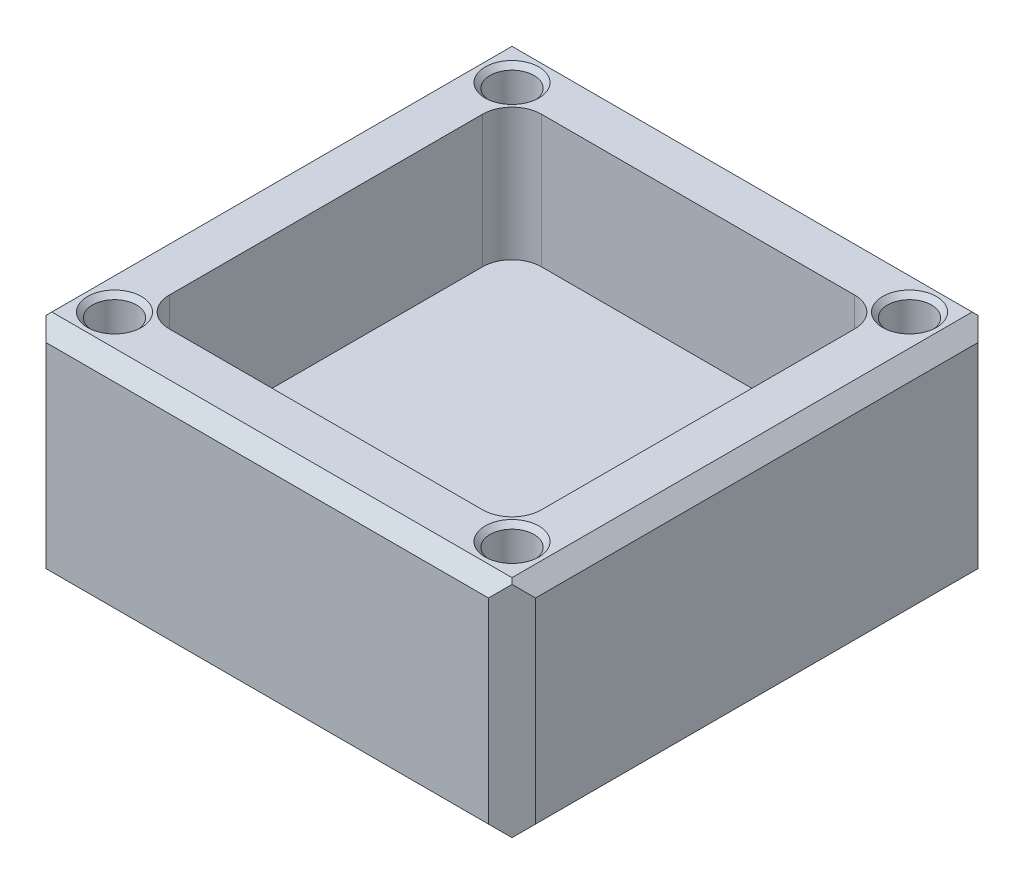
from build123d import *

# Parameters (mm, degrees)
BOSS_EXTRUDE1_DEPTH                          = 50
CUT_EXTRUDE1_DEPTH                           = 50
CUT_EXTRUDE2_DEPTH                           = 13.5
SKETCH4_R                                    = 2.25
CUT_EXTRUDE3_DEPTH                           = 18
CSK_FOR_M2_5_COUNTERSUNK_FLAT_HEAD_S_2_COUNT = 2
CSK_FOR_M2_5_COUNTERSUNK_FLAT_HEAD_S_2_PITCH = 40.6
CSK_FOR_M2_5_COUNTERSUNK_FLAT_HEAD_S_3_COUNT = 2
CSK_FOR_M2_5_COUNTERSUNK_FLAT_HEAD_S_3_PITCH = 57.417070632
CSK_FOR_M2_5_COUNTERSUNK_FLAT_HEAD_S_4_COUNT = 2
CSK_FOR_M2_5_COUNTERSUNK_FLAT_HEAD_S_4_PITCH = 40.6
CUT_EXTRUDE4_DEPTH                           = 76
CUT_EXTRUDE6_DEPTH                           = 1


with BuildPart() as part:
    # Sketch1 → Boss-Extrude1 (new body)
    with BuildSketch(Plane.XY):
        Polygon((0, -21.5), (3.5, -25), (46.5, -25), (50, -21.5), (50, -1.5), (48.5, 0), (1.5, 0), (0, -1.5), align=None)
    extrude(amount=BOSS_EXTRUDE1_DEPTH)

    # Sketch2 → Cut-Extrude1 (cut)
    with BuildSketch(Plane.ZY):
        Polygon((48.5, 0), (50, -1.5), (50, 0), align=None)
        Polygon((50, -21.5), (46.5, -25), (50, -25), align=None)
        Polygon((1.5, 0), (0, 0), (0, -1.5), align=None)
        Polygon((3.5, -25), (0, -25), (0, -21.5), align=None)
    extrude(amount=-CUT_EXTRUDE1_DEPTH, mode=Mode.SUBTRACT)

    # Sketch3 → Cut-Extrude2 (cut)
    with BuildSketch(Plane(origin=(0, 0, 0), x_dir=(1, 0, 0), z_dir=(0, 1, 0))):
        with BuildLine():
            Line((9, -6), (41, -6))
            ThreePointArc((41, -6), (43.121320344, -6.878679656), (44, -9))
            Line((44, -9), (44, -41))
            ThreePointArc((44, -41), (43.121320344, -43.121320344), (41, -44))
            Line((41, -44), (9, -44))
            ThreePointArc((9, -44), (6.878679656, -43.121320344), (6, -41))
            Line((6, -41), (6, -9))
            ThreePointArc((6, -9), (6.878679656, -6.878679656), (9, -6))
        make_face()
    extrude(amount=-CUT_EXTRUDE2_DEPTH, mode=Mode.SUBTRACT)

    # Sketch4 → Cut-Extrude3 (cut)
    with BuildSketch(Plane(origin=(0, 0, 0), x_dir=(1, 0, 0), z_dir=(0, 1, 0))):
        with Locations((4.7, -4.7)):
            Circle(SKETCH4_R)
        with Locations((45.3, -4.7)):
            Circle(SKETCH4_R)
        with Locations((45.3, -45.3)):
            Circle(SKETCH4_R)
        with Locations((4.7, -45.3)):
            Circle(SKETCH4_R)
    extrude(amount=-CUT_EXTRUDE3_DEPTH, mode=Mode.SUBTRACT)

    # Sketch6 → CSK for M2.5 Countersunk Flat Head Screw1 (revolve, cut)
    with BuildSketch(Plane(origin=(4.7, 0, 4.7), x_dir=(0, 0, 1), z_dir=(1, 0, 0))):
        Polygon((0, 0), (0, 1.72), (1.45, 0.848752102), (1.45, 1.3), (2.75, 0), align=None)
    csk_for_m2_5_countersunk_flat_head_screw = revolve(axis=Axis((4.7, 6.35, 4.7), (0, -1, 0)), mode=Mode.SUBTRACT)

    # CSK for M2.5 Countersunk Flat Head S 2: CSK for M2.5 Countersunk Flat Head Screw1 ×2
    with Locations(*[(i * CSK_FOR_M2_5_COUNTERSUNK_FLAT_HEAD_S_2_PITCH, 0, 0) for i in range(1, CSK_FOR_M2_5_COUNTERSUNK_FLAT_HEAD_S_2_COUNT)]):
        add(csk_for_m2_5_countersunk_flat_head_screw, mode=Mode.SUBTRACT)

    # CSK for M2.5 Countersunk Flat Head S 3: CSK for M2.5 Countersunk Flat Head Screw1 ×2
    with Locations(*[Vector(0.7071067811865577, 0, 0.7071067811865374) * (i * CSK_FOR_M2_5_COUNTERSUNK_FLAT_HEAD_S_3_PITCH) for i in range(1, CSK_FOR_M2_5_COUNTERSUNK_FLAT_HEAD_S_3_COUNT)]):
        add(csk_for_m2_5_countersunk_flat_head_screw, mode=Mode.SUBTRACT)

    # CSK for M2.5 Countersunk Flat Head S 4: CSK for M2.5 Countersunk Flat Head Screw1 ×2
    with Locations(*[(0, 0, i * CSK_FOR_M2_5_COUNTERSUNK_FLAT_HEAD_S_4_PITCH) for i in range(1, CSK_FOR_M2_5_COUNTERSUNK_FLAT_HEAD_S_4_COUNT)]):
        add(csk_for_m2_5_countersunk_flat_head_screw, mode=Mode.SUBTRACT)

    # Sketch7 → Cut-Extrude4 (cut, through all)
    with BuildSketch(Plane(origin=(0, 0, 0), x_dir=(1, 0, 0), z_dir=(0, 1, 0))):
        Polygon((0, -2.404163056), (2.404163056, 0), (0, 0), align=None)
        Polygon((50, 0), (47.595836944, 0), (50, -2.404163056), align=None)
        Polygon((50, -50), (50, -47.595836944), (47.595836944, -50), align=None)
        Polygon((0, -50), (2.404163056, -50), (0, -47.595836944), align=None)
    extrude(amount=-CUT_EXTRUDE4_DEPTH, mode=Mode.SUBTRACT)

    # Sketch9 → Cut-Extrude6 (cut)
    # profile 1 of 19: a face of its own
    with BuildSketch(Plane.XZ.offset(25)):
        with BuildLine():
            Line((7.415693007, 33.287789025), (7.415693007, 30.137595809))
            Line((7.415693007, 30.137595809), (7.94072521, 30.137595809))
            ThreePointArc((7.94072521, 30.137595809), (8.040609304, 30.140443127), (8.140168983, 30.148975987))
            ThreePointArc((8.140168983, 30.148975987), (8.223030328, 30.162498536), (8.304223695, 30.183864377))
            ThreePointArc((8.304223695, 30.183864377), (8.360515407, 30.205691148), (8.413513558, 30.23461105))
            ThreePointArc((8.413513558, 30.23461105), (8.436251965, 30.260762451), (8.440887477, 30.29510547))
            ThreePointArc((8.440887477, 30.29510547), (8.434141115, 30.351725675), (8.431714325, 30.408694717))
            ThreePointArc((8.431714325, 30.408694717), (8.43090002, 30.646573798), (8.430628558, 30.884454118))
            ThreePointArc((8.430628558, 30.884454118), (8.43126242, 31.164811264), (8.433164043, 31.445162678))
            ThreePointArc((8.433164043, 31.445162678), (8.436530737, 31.762694839), (8.440887477, 32.080214959))
            ThreePointArc((8.440887477, 32.080214959), (8.45146783, 32.605460442), (8.467155048, 33.130578213))
            ThreePointArc((8.467155048, 33.130578213), (8.486809954, 33.312709576), (8.532672137, 33.490064612))
            ThreePointArc((8.532672137, 33.490064612), (8.591933274, 33.58783019), (8.687079907, 33.651210856))
            ThreePointArc((8.687079907, 33.651210856), (8.836319886, 33.693542995), (8.990789615, 33.707814787))
            ThreePointArc((8.990789615, 33.707814787), (9.146050787, 33.69244572), (9.295285611, 33.646935203))
            ThreePointArc((9.295285611, 33.646935203), (9.390828922, 33.579130983), (9.44787656, 33.476800618))
            ThreePointArc((9.44787656, 33.476800618), (9.490060058, 33.286910642), (9.506320415, 33.093072432))
            ThreePointArc((9.506320415, 33.093072432), (9.513446377, 32.507908148), (9.515821818, 31.922705298))
            ThreePointArc((9.515821818, 31.922705298), (9.518454862, 31.383566433), (9.526353964, 30.844479006))
            ThreePointArc((9.526353964, 30.844479006), (9.542101874, 30.627420436), (9.580678836, 30.413237716))
            ThreePointArc((9.580678836, 30.413237716), (9.627566899, 30.302983961), (9.708717809, 30.214842537))
            ThreePointArc((9.708717809, 30.214842537), (9.815894467, 30.157435768), (9.93584758, 30.137595809))
            ThreePointArc((9.93584758, 30.137595809), (10.068231164, 30.170066646), (10.170564906, 30.260108714))
            ThreePointArc((10.170564906, 30.260108714), (10.252827802, 30.414468069), (10.296369762, 30.583873182))
            ThreePointArc((10.296369762, 30.583873182), (10.332763543, 30.940722014), (10.34703705, 31.299137782))
            ThreePointArc((10.34703705, 31.299137782), (10.353664588, 32.293453587), (10.355873342, 33.287789025))
            ThreePointArc((10.355873342, 33.287789025), (10.353664588, 34.282124464), (10.34703705, 35.276440268))
            ThreePointArc((10.34703705, 35.276440268), (10.332763543, 35.634856037), (10.296369762, 35.991704869))
            ThreePointArc((10.296369762, 35.991704869), (10.252827802, 36.161109982), (10.170564906, 36.315469337))
            ThreePointArc((10.170564906, 36.315469337), (10.068231164, 36.405511404), (9.93584758, 36.437982241))
            ThreePointArc((9.93584758, 36.437982241), (9.827111432, 36.427844457), (9.722123351, 36.397780735))
            ThreePointArc((9.722123351, 36.397780735), (9.648299617, 36.352244905), (9.595364617, 36.283532888))
            ThreePointArc((9.595364617, 36.283532888), (9.552242987, 36.174009472), (9.531856301, 36.05808175))
            ThreePointArc((9.531856301, 36.05808175), (9.519831782, 35.840395054), (9.515821818, 35.622413388))
            ThreePointArc((9.515821818, 35.622413388), (9.511072417, 35.395941765), (9.496832243, 35.169868392))
            ThreePointArc((9.496832243, 35.169868392), (9.472912956, 35.047495915), (9.423057868, 34.933208446))
            ThreePointArc((9.423057868, 34.933208446), (9.357731033, 34.851975426), (9.270531603, 34.794855741))
            ThreePointArc((9.270531603, 34.794855741), (9.133251216, 34.742466958), (8.990789615, 34.70647833))
            ThreePointArc((8.990789615, 34.70647833), (8.838287197, 34.684735496), (8.684413374, 34.677483952))
            ThreePointArc((8.684413374, 34.677483952), (8.603643276, 34.698093532), (8.542603226, 34.754862148))
            ThreePointArc((8.542603226, 34.754862148), (8.496770565, 34.852263067), (8.477975962, 34.958255213))
            ThreePointArc((8.477975962, 34.958255213), (8.468812344, 35.240085004), (8.465757413, 35.522047183))
            ThreePointArc((8.465757413, 35.522047183), (8.462091672, 35.793097163), (8.451097253, 36.06394888))
            ThreePointArc((8.451097253, 36.06394888), (8.430594241, 36.182896089), (8.383158296, 36.293885473))
            ThreePointArc((8.383158296, 36.293885473), (8.320649405, 36.364346463), (8.235221233, 36.404021898))
            ThreePointArc((8.235221233, 36.404021898), (8.088949038, 36.429464118), (7.94072521, 36.437982241))
            Line((7.94072521, 36.437982241), (7.415693007, 36.437982241))
            Line((7.415693007, 36.437982241), (7.415693007, 33.287789025))
        make_face()
    # profile 2 of 19: a face of its own
    with BuildSketch(Plane.XZ.offset(25)):
        with BuildLine():
            Line((11.195924866, 33.287789025), (11.195924866, 30.137595809))
            Line((11.195924866, 30.137595809), (12.350995712, 30.137595809))
            ThreePointArc((12.350995712, 30.137595809), (12.708115151, 30.140672808), (13.065128553, 30.149902774))
            ThreePointArc((13.065128553, 30.149902774), (13.204742809, 30.168511375), (13.338056253, 30.213964053))
            ThreePointArc((13.338056253, 30.213964053), (13.418050146, 30.274129951), (13.465109846, 30.362472142))
            ThreePointArc((13.465109846, 30.362472142), (13.495780144, 30.511159371), (13.506066558, 30.662628012))
            ThreePointArc((13.506066558, 30.662628012), (13.498767188, 30.806409091), (13.476944492, 30.948711759))
            ThreePointArc((13.476944492, 30.948711759), (13.442585787, 31.032344828), (13.380058829, 31.097654784))
            ThreePointArc((13.380058829, 31.097654784), (13.286797794, 31.14699487), (13.183817543, 31.169954239))
            ThreePointArc((13.183817543, 31.169954239), (12.977609281, 31.183231575), (12.771021474, 31.187660215))
            ThreePointArc((12.771021474, 31.187660215), (12.538770019, 31.193228038), (12.307052197, 31.20991906))
            ThreePointArc((12.307052197, 31.20991906), (12.208099834, 31.240457675), (12.129315355, 31.307667665))
            ThreePointArc((12.129315355, 31.307667665), (12.073613119, 31.407765993), (12.050707114, 31.520005599))
            ThreePointArc((12.050707114, 31.520005599), (12.039659656, 31.826273365), (12.03597639, 32.132718179))
            ThreePointArc((12.03597639, 32.132718179), (12.039659656, 32.439162994), (12.050707114, 32.74543076))
            ThreePointArc((12.050707114, 32.74543076), (12.073613119, 32.857670366), (12.129315355, 32.957768694))
            ThreePointArc((12.129315355, 32.957768694), (12.208099834, 33.024978684), (12.307052197, 33.055517299))
            ThreePointArc((12.307052197, 33.055517299), (12.538770019, 33.072208321), (12.771021474, 33.077776144))
            ThreePointArc((12.771021474, 33.077776144), (12.977609281, 33.082204784), (13.183817543, 33.09548212))
            ThreePointArc((13.183817543, 33.09548212), (13.286797794, 33.118441489), (13.380058829, 33.167781575))
            ThreePointArc((13.380058829, 33.167781575), (13.442585787, 33.233091531), (13.476944492, 33.3167246))
            ThreePointArc((13.476944492, 33.3167246), (13.498767188, 33.459027268), (13.506066558, 33.602808347))
            ThreePointArc((13.506066558, 33.602808347), (13.498767188, 33.746589426), (13.476944492, 33.888892094))
            ThreePointArc((13.476944492, 33.888892094), (13.442585787, 33.972525163), (13.380058829, 34.037835119))
            ThreePointArc((13.380058829, 34.037835119), (13.286797794, 34.087175204), (13.183817543, 34.110134573))
            ThreePointArc((13.183817543, 34.110134573), (12.977609281, 34.12341191), (12.771021474, 34.127840549))
            ThreePointArc((12.771021474, 34.127840549), (12.554403006, 34.132466277), (12.338179466, 34.146334914))
            ThreePointArc((12.338179466, 34.146334914), (12.237750914, 34.171040295), (12.149733438, 34.22534659))
            ThreePointArc((12.149733438, 34.22534659), (12.089083823, 34.300545647), (12.05944932, 34.392497102))
            ThreePointArc((12.05944932, 34.392497102), (12.03597639, 34.757879193), (12.05944932, 35.123261283))
            ThreePointArc((12.05944932, 35.123261283), (12.089083823, 35.215212738), (12.149733438, 35.290411795))
            ThreePointArc((12.149733438, 35.290411795), (12.237750914, 35.34471809), (12.338179466, 35.369423471))
            ThreePointArc((12.338179466, 35.369423471), (12.554403006, 35.383292108), (12.771021474, 35.387917836))
            ThreePointArc((12.771021474, 35.387917836), (12.977609281, 35.392346475), (13.183817543, 35.405623812))
            ThreePointArc((13.183817543, 35.405623812), (13.286797794, 35.428583181), (13.380058829, 35.477923266))
            ThreePointArc((13.380058829, 35.477923266), (13.442585787, 35.543233222), (13.476944492, 35.626866292))
            ThreePointArc((13.476944492, 35.626866292), (13.498767188, 35.76916896), (13.506066558, 35.912950038))
            ThreePointArc((13.506066558, 35.912950038), (13.495780144, 36.064418679), (13.465109846, 36.213105908))
            ThreePointArc((13.465109846, 36.213105908), (13.418050146, 36.3014481), (13.338056253, 36.361613997))
            ThreePointArc((13.338056253, 36.361613997), (13.204742809, 36.407066675), (13.065128553, 36.425675276))
            ThreePointArc((13.065128553, 36.425675276), (12.708115151, 36.434905243), (12.350995712, 36.437982241))
            Line((12.350995712, 36.437982241), (11.195924866, 36.437982241))
            Line((11.195924866, 36.437982241), (11.195924866, 33.287789025))
        make_face()
    # profile 3 of 19: a face of its own
    with BuildSketch(Plane.XZ.offset(25)):
        with BuildLine():
            Line((22.011588241, 30.137595809), (22.536620443, 30.137595809))
            Line((22.536620443, 30.137595809), (22.536620443, 33.287789025))
            Line((22.536620443, 33.287789025), (22.536620443, 36.437982241))
            Line((22.536620443, 36.437982241), (22.011588241, 36.437982241))
            ThreePointArc((22.011588241, 36.437982241), (21.864932551, 36.429990838), (21.720013497, 36.406111526))
            ThreePointArc((21.720013497, 36.406111526), (21.635413632, 36.368700442), (21.571873771, 36.301473868))
            ThreePointArc((21.571873771, 36.301473868), (21.523684493, 36.197797178), (21.502306794, 36.085484861))
            ThreePointArc((21.502306794, 36.085484861), (21.49049466, 35.841834968), (21.486556038, 35.597930717))
            ThreePointArc((21.486556038, 35.597930717), (21.482617416, 35.354026465), (21.470805282, 35.110376573))
            ThreePointArc((21.470805282, 35.110376573), (21.449427583, 34.998064256), (21.401238305, 34.894387565))
            ThreePointArc((21.401238305, 34.894387565), (21.337698443, 34.827160991), (21.253098579, 34.789749907))
            ThreePointArc((21.253098579, 34.789749907), (21.108179525, 34.765870596), (20.961523835, 34.757879193))
            ThreePointArc((20.961523835, 34.757879193), (20.814868146, 34.765870596), (20.669949092, 34.789749907))
            ThreePointArc((20.669949092, 34.789749907), (20.585349227, 34.827160991), (20.521809366, 34.894387565))
            ThreePointArc((20.521809366, 34.894387565), (20.473620087, 34.998064256), (20.452242389, 35.110376573))
            ThreePointArc((20.452242389, 35.110376573), (20.440430255, 35.354026465), (20.436491633, 35.597930717))
            ThreePointArc((20.436491633, 35.597930717), (20.432562054, 35.823918961), (20.420778259, 36.049633982))
            ThreePointArc((20.420778259, 36.049633982), (20.400666267, 36.168168979), (20.357736802, 36.28047258))
            ThreePointArc((20.357736802, 36.28047258), (20.305091402, 36.350337134), (20.23101209, 36.396865079))
            ThreePointArc((20.23101209, 36.396865079), (20.125691202, 36.427610207), (20.016465871, 36.437982241))
            ThreePointArc((20.016465871, 36.437982241), (19.884082286, 36.405511404), (19.781748544, 36.315469337))
            ThreePointArc((19.781748544, 36.315469337), (19.699485648, 36.161109982), (19.655943688, 35.991704869))
            ThreePointArc((19.655943688, 35.991704869), (19.619549908, 35.634856037), (19.6052764, 35.276440268))
            ThreePointArc((19.6052764, 35.276440268), (19.598648863, 34.282124464), (19.596440108, 33.287789025))
            ThreePointArc((19.596440108, 33.287789025), (19.598648863, 32.293453587), (19.6052764, 31.299137782))
            ThreePointArc((19.6052764, 31.299137782), (19.619549908, 30.940722014), (19.655943688, 30.583873182))
            ThreePointArc((19.655943688, 30.583873182), (19.699485648, 30.414468069), (19.781748544, 30.260108714))
            ThreePointArc((19.781748544, 30.260108714), (19.884082286, 30.170066646), (20.016465871, 30.137595809))
            ThreePointArc((20.016465871, 30.137595809), (20.136418983, 30.157435768), (20.243595641, 30.214842537))
            ThreePointArc((20.243595641, 30.214842537), (20.324746552, 30.302983961), (20.371634615, 30.413237716))
            ThreePointArc((20.371634615, 30.413237716), (20.410211576, 30.627420436), (20.425959487, 30.844479006))
            ThreePointArc((20.425959487, 30.844479006), (20.433858588, 31.383566433), (20.436491633, 31.922705298))
            ThreePointArc((20.436491633, 31.922705298), (20.438867074, 32.507908148), (20.445993035, 33.093072432))
            ThreePointArc((20.445993035, 33.093072432), (20.462253392, 33.286910642), (20.50443689, 33.476800618))
            ThreePointArc((20.50443689, 33.476800618), (20.561484529, 33.579130983), (20.657027839, 33.646935203))
            ThreePointArc((20.657027839, 33.646935203), (20.806262663, 33.69244572), (20.961523835, 33.707814787))
            ThreePointArc((20.961523835, 33.707814787), (21.116785007, 33.69244572), (21.266019831, 33.646935203))
            ThreePointArc((21.266019831, 33.646935203), (21.361563142, 33.579130983), (21.41861078, 33.476800618))
            ThreePointArc((21.41861078, 33.476800618), (21.460794278, 33.286910642), (21.477054635, 33.093072432))
            ThreePointArc((21.477054635, 33.093072432), (21.484180597, 32.507908148), (21.486556038, 31.922705298))
            ThreePointArc((21.486556038, 31.922705298), (21.488931479, 31.337502448), (21.496057441, 30.752338164))
            ThreePointArc((21.496057441, 30.752338164), (21.512317797, 30.558499955), (21.554501295, 30.368609979))
            ThreePointArc((21.554501295, 30.368609979), (21.611548934, 30.266279614), (21.707092244, 30.198475393))
            ThreePointArc((21.707092244, 30.198475393), (21.856327068, 30.152964877), (22.011588241, 30.137595809))
        make_face()
    # profile 4 of 19: a face of its own
    with BuildSketch(Plane.XZ.offset(25)):
        with BuildLine():
            Line((34.087328901, 33.287789025), (34.087328901, 30.137595809))
            Line((34.087328901, 30.137595809), (35.137393306, 30.137595809))
            ThreePointArc((35.137393306, 30.137595809), (35.456648382, 30.140891777), (35.775767361, 30.150778318))
            ThreePointArc((35.775767361, 30.150778318), (35.906332482, 30.170095063), (36.029948051, 30.21635064))
            ThreePointArc((36.029948051, 30.21635064), (36.105862486, 30.277408364), (36.149637962, 30.364441433))
            ThreePointArc((36.149637962, 30.364441433), (36.177965016, 30.512340318), (36.187457712, 30.662628012))
            ThreePointArc((36.187457712, 30.662628012), (36.180797209, 30.80233607), (36.160875961, 30.940776842))
            ThreePointArc((36.160875961, 30.940776842), (36.129448149, 31.023785943), (36.071950627, 31.091404381))
            ThreePointArc((36.071950627, 31.091404381), (35.989605492, 31.142020622), (35.896295643, 31.167239612))
            ThreePointArc((35.896295643, 31.167239612), (35.727164717, 31.182550514), (35.557419068, 31.187660215))
            Line((35.557419068, 31.187660215), (34.927380425, 31.187660215))
            Line((34.927380425, 31.187660215), (34.927380425, 33.812821228))
            ThreePointArc((34.927380425, 33.812821228), (34.925065057, 34.631982002), (34.918118227, 35.451116592))
            ThreePointArc((34.918118227, 35.451116592), (34.903468225, 35.755176842), (34.86647669, 36.057333894))
            ThreePointArc((34.86647669, 36.057333894), (34.821880937, 36.203279218), (34.739227155, 36.331564724))
            ThreePointArc((34.739227155, 36.331564724), (34.634917927, 36.410107523), (34.507354663, 36.437982241))
            ThreePointArc((34.507354663, 36.437982241), (34.374971079, 36.405511404), (34.272637337, 36.315469337))
            ThreePointArc((34.272637337, 36.315469337), (34.190374441, 36.161109982), (34.146832481, 35.991704869))
            ThreePointArc((34.146832481, 35.991704869), (34.1104387, 35.634856037), (34.096165193, 35.276440268))
            ThreePointArc((34.096165193, 35.276440268), (34.089537656, 34.282124464), (34.087328901, 33.287789025))
        make_face()
    # profile 5 of 19: a face of its own
    with BuildSketch(Plane.XZ.offset(25)):
        with BuildLine():
            Line((39.250232856, 30.137595809), (39.792853427, 30.137595809))
            Line((39.792853427, 30.137595809), (39.722761838, 32.653553695))
            ThreePointArc((39.722761838, 32.653553695), (39.697777135, 33.432258464), (39.6662165, 34.210724443))
            ThreePointArc((39.6662165, 34.210724443), (39.638005751, 34.549124286), (39.583893761, 34.88435882))
            ThreePointArc((39.583893761, 34.88435882), (39.519601696, 35.105679449), (39.419105473, 35.313084366))
            ThreePointArc((39.419105473, 35.313084366), (39.27572452, 35.523534504), (39.107179012, 35.714426542))
            ThreePointArc((39.107179012, 35.714426542), (38.969767084, 35.83910513), (38.821033311, 35.950033273))
            ThreePointArc((38.821033311, 35.950033273), (38.651841993, 36.054653833), (38.475014198, 36.145775149))
            ThreePointArc((38.475014198, 36.145775149), (38.285509253, 36.225684366), (38.090512955, 36.29106059))
            ThreePointArc((38.090512955, 36.29106059), (37.891677185, 36.341327674), (37.689592064, 36.376314059))
            Line((37.689592064, 36.376314059), (36.817496355, 36.493286613))
            Line((36.817496355, 36.493286613), (36.817496355, 33.315441211))
            ThreePointArc((36.817496355, 33.315441211), (36.819700558, 32.311877937), (36.826314376, 31.308334036))
            ThreePointArc((36.826314376, 31.308334036), (36.840571545, 30.947055682), (36.876939031, 30.587329784))
            ThreePointArc((36.876939031, 30.587329784), (36.920430343, 30.416661649), (37.002654211, 30.260910753))
            ThreePointArc((37.002654211, 30.260910753), (37.104885836, 30.170298648), (37.237522117, 30.137595809))
            ThreePointArc((37.237522117, 30.137595809), (37.34129644, 30.146023044), (37.44235125, 30.171084043))
            ThreePointArc((37.44235125, 30.171084043), (37.514320198, 30.209359538), (37.570042442, 30.26885386))
            ThreePointArc((37.570042442, 30.26885386), (37.614831533, 30.356658189), (37.638173561, 30.452422549))
            ThreePointArc((37.638173561, 30.452422549), (37.652699695, 30.609731076), (37.657547879, 30.767634453))
            ThreePointArc((37.657547879, 30.767634453), (37.66265758, 30.937380101), (37.677968482, 31.106511027))
            ThreePointArc((37.677968482, 31.106511027), (37.703187471, 31.199820876), (37.753803713, 31.282166011))
            ThreePointArc((37.753803713, 31.282166011), (37.821422151, 31.339663534), (37.904431252, 31.371091345))
            ThreePointArc((37.904431252, 31.371091345), (38.042872024, 31.391012593), (38.182580082, 31.397673096))
            ThreePointArc((38.182580082, 31.397673096), (38.322288139, 31.391012593), (38.460728912, 31.371091345))
            ThreePointArc((38.460728912, 31.371091345), (38.543738013, 31.339663534), (38.61135645, 31.282166011))
            ThreePointArc((38.61135645, 31.282166011), (38.661972692, 31.199820876), (38.687191682, 31.106511027))
            ThreePointArc((38.687191682, 31.106511027), (38.702502584, 30.937380101), (38.707612284, 30.767634453))
            ThreePointArc((38.707612284, 30.767634453), (38.712774652, 30.596344086), (38.72824332, 30.425675519))
            ThreePointArc((38.72824332, 30.425675519), (38.753806037, 30.332636485), (38.805333798, 30.251060729))
            ThreePointArc((38.805333798, 30.251060729), (38.874813388, 30.193850843), (38.959453011, 30.163248253))
            ThreePointArc((38.959453011, 30.163248253), (39.104278272, 30.144021385), (39.250232856, 30.137595809))
        make_face()
        with BuildLine():
            ThreePointArc((38.555723408, 34.959871682), (38.517535765, 35.05464192), (38.455596827, 35.135902378))
            ThreePointArc((38.455596827, 35.135902378), (38.280695999, 35.278738049), (38.080783268, 35.38374866))
            ThreePointArc((38.080783268, 35.38374866), (37.940413603, 35.388004154), (37.830798635, 35.300218557))
            ThreePointArc((37.830798635, 35.300218557), (37.732555189, 35.081635407), (37.689250163, 34.845934233))
            ThreePointArc((37.689250163, 34.845934233), (37.665475561, 34.329620871), (37.657547879, 33.812821228))
            ThreePointArc((37.657547879, 33.812821228), (37.660084196, 33.303738489), (37.667692761, 32.794706292))
            ThreePointArc((37.667692761, 32.794706292), (37.684507185, 32.618959243), (37.727552103, 32.447737501))
            ThreePointArc((37.727552103, 32.447737501), (37.785370662, 32.352556838), (37.878728825, 32.291839479))
            ThreePointArc((37.878728825, 32.291839479), (38.028263848, 32.251358964), (38.182580082, 32.23772462))
            ThreePointArc((38.182580082, 32.23772462), (38.335442054, 32.249323306), (38.484803948, 32.283853529))
            ThreePointArc((38.484803948, 32.283853529), (38.575229282, 32.336284164), (38.634274526, 32.422535955))
            ThreePointArc((38.634274526, 32.422535955), (38.678629078, 32.571141905), (38.696366935, 32.7252082))
            ThreePointArc((38.696366935, 32.7252082), (38.704800977, 33.14296915), (38.707612284, 33.560805771))
            ThreePointArc((38.707612284, 33.560805771), (38.70310704, 33.828353717), (38.689596959, 34.095598322))
            ThreePointArc((38.689596959, 34.095598322), (38.6678335, 34.336292682), (38.635107857, 34.575743001))
            ThreePointArc((38.635107857, 34.575743001), (38.599750909, 34.768703274), (38.555723408, 34.959871682))
        make_face(mode=Mode.SUBTRACT)
    # profile 6 of 19: a face of its own
    with BuildSketch(Plane.XZ.offset(25)):
        with BuildLine():
            Line((41.8578055, 32.762756823), (41.8578055, 35.387917836))
            Line((41.8578055, 35.387917836), (42.382837703, 35.387917836))
            ThreePointArc((42.382837703, 35.387917836), (42.516593167, 35.394007302), (42.649241983, 35.412225357))
            ThreePointArc((42.649241983, 35.412225357), (42.732186205, 35.440898893), (42.802863465, 35.492924276))
            ThreePointArc((42.802863465, 35.492924276), (42.854888849, 35.563601536), (42.883562384, 35.646545759))
            ThreePointArc((42.883562384, 35.646545759), (42.901780439, 35.779194574), (42.907869905, 35.912950038))
            ThreePointArc((42.907869905, 35.912950038), (42.895936827, 36.066094507), (42.860425475, 36.215542058))
            ThreePointArc((42.860425475, 36.215542058), (42.806631853, 36.306476031), (42.718858312, 36.365285442))
            ThreePointArc((42.718858312, 36.365285442), (42.566460894, 36.409396415), (42.408782484, 36.426954045))
            ThreePointArc((42.408782484, 36.426954045), (41.97581944, 36.435225042), (41.542786179, 36.437982241))
            ThreePointArc((41.542786179, 36.437982241), (41.109752917, 36.435225042), (40.676789873, 36.426954045))
            ThreePointArc((40.676789873, 36.426954045), (40.519111463, 36.409396415), (40.366714045, 36.365285442))
            ThreePointArc((40.366714045, 36.365285442), (40.278940504, 36.306476031), (40.225146882, 36.215542058))
            ThreePointArc((40.225146882, 36.215542058), (40.18963553, 36.066094507), (40.177702452, 35.912950038))
            ThreePointArc((40.177702452, 35.912950038), (40.183303674, 35.788249827), (40.200062103, 35.664553943))
            ThreePointArc((40.200062103, 35.664553943), (40.226273541, 35.580813296), (40.272208248, 35.506050081))
            ThreePointArc((40.272208248, 35.506050081), (40.330168813, 35.452305287), (40.401311987, 35.417858532))
            ThreePointArc((40.401311987, 35.417858532), (40.498385647, 35.395445973), (40.597728214, 35.387917836))
            ThreePointArc((40.597728214, 35.387917836), (40.725291478, 35.360043118), (40.829600706, 35.281500319))
            ThreePointArc((40.829600706, 35.281500319), (40.912254487, 35.153214813), (40.95685024, 35.007269489))
            ThreePointArc((40.95685024, 35.007269489), (40.993841775, 34.705112436), (41.008491778, 34.401052187))
            ThreePointArc((41.008491778, 34.401052187), (41.015438607, 33.581917597), (41.017753976, 32.762756823))
            ThreePointArc((41.017753976, 32.762756823), (41.020069344, 31.943596048), (41.027016174, 31.124461458))
            ThreePointArc((41.027016174, 31.124461458), (41.041666176, 30.820401209), (41.078657711, 30.518244156))
            ThreePointArc((41.078657711, 30.518244156), (41.123253464, 30.372298833), (41.205907246, 30.244013326))
            ThreePointArc((41.205907246, 30.244013326), (41.310216474, 30.165470527), (41.437779738, 30.137595809))
            ThreePointArc((41.437779738, 30.137595809), (41.565343002, 30.165470527), (41.66965223, 30.244013326))
            ThreePointArc((41.66965223, 30.244013326), (41.752306012, 30.372298833), (41.796901765, 30.518244156))
            ThreePointArc((41.796901765, 30.518244156), (41.8338933, 30.820401209), (41.848543302, 31.124461458))
            ThreePointArc((41.848543302, 31.124461458), (41.855490132, 31.943596048), (41.8578055, 32.762756823))
        make_face()
    # profile 7 of 19: a face of its own
    with BuildSketch(Plane.XZ.offset(25)):
        with BuildLine():
            Line((43.537908549, 33.287789025), (43.537908549, 30.137595809))
            Line((43.537908549, 30.137595809), (44.692979394, 30.137595809))
            ThreePointArc((44.692979394, 30.137595809), (45.050098833, 30.140672808), (45.407112235, 30.149902774))
            ThreePointArc((45.407112235, 30.149902774), (45.546726491, 30.168511375), (45.680039935, 30.213964053))
            ThreePointArc((45.680039935, 30.213964053), (45.760033828, 30.274129951), (45.807093528, 30.362472142))
            ThreePointArc((45.807093528, 30.362472142), (45.837763827, 30.511159371), (45.84805024, 30.662628012))
            ThreePointArc((45.84805024, 30.662628012), (45.840750871, 30.806409091), (45.818928174, 30.948711759))
            ThreePointArc((45.818928174, 30.948711759), (45.78456947, 31.032344828), (45.722042511, 31.097654784))
            ThreePointArc((45.722042511, 31.097654784), (45.628781476, 31.14699487), (45.525801225, 31.169954239))
            ThreePointArc((45.525801225, 31.169954239), (45.319592963, 31.183231575), (45.113005156, 31.187660215))
            ThreePointArc((45.113005156, 31.187660215), (44.880753701, 31.193228038), (44.649035879, 31.20991906))
            ThreePointArc((44.649035879, 31.20991906), (44.550083517, 31.240457675), (44.471299038, 31.307667665))
            ThreePointArc((44.471299038, 31.307667665), (44.415596802, 31.407765993), (44.392690796, 31.520005599))
            ThreePointArc((44.392690796, 31.520005599), (44.381643338, 31.826273365), (44.377960073, 32.132718179))
            ThreePointArc((44.377960073, 32.132718179), (44.381643338, 32.439162994), (44.392690796, 32.74543076))
            ThreePointArc((44.392690796, 32.74543076), (44.415596802, 32.857670366), (44.471299038, 32.957768694))
            ThreePointArc((44.471299038, 32.957768694), (44.550083517, 33.024978684), (44.649035879, 33.055517299))
            ThreePointArc((44.649035879, 33.055517299), (44.880753701, 33.072208321), (45.113005156, 33.077776144))
            ThreePointArc((45.113005156, 33.077776144), (45.319592963, 33.082204784), (45.525801225, 33.09548212))
            ThreePointArc((45.525801225, 33.09548212), (45.628781476, 33.118441489), (45.722042511, 33.167781575))
            ThreePointArc((45.722042511, 33.167781575), (45.78456947, 33.233091531), (45.818928174, 33.3167246))
            ThreePointArc((45.818928174, 33.3167246), (45.840750871, 33.459027268), (45.84805024, 33.602808347))
            ThreePointArc((45.84805024, 33.602808347), (45.840750871, 33.746589426), (45.818928174, 33.888892094))
            ThreePointArc((45.818928174, 33.888892094), (45.78456947, 33.972525163), (45.722042511, 34.037835119))
            ThreePointArc((45.722042511, 34.037835119), (45.628781476, 34.087175204), (45.525801225, 34.110134573))
            ThreePointArc((45.525801225, 34.110134573), (45.319592963, 34.12341191), (45.113005156, 34.127840549))
            ThreePointArc((45.113005156, 34.127840549), (44.896386688, 34.132466277), (44.680163148, 34.146334914))
            ThreePointArc((44.680163148, 34.146334914), (44.579734597, 34.171040295), (44.49171712, 34.22534659))
            ThreePointArc((44.49171712, 34.22534659), (44.431067505, 34.300545647), (44.401433002, 34.392497102))
            ThreePointArc((44.401433002, 34.392497102), (44.377960073, 34.757879193), (44.401433002, 35.123261283))
            ThreePointArc((44.401433002, 35.123261283), (44.431067505, 35.215212738), (44.49171712, 35.290411795))
            ThreePointArc((44.49171712, 35.290411795), (44.579734597, 35.34471809), (44.680163148, 35.369423471))
            ThreePointArc((44.680163148, 35.369423471), (44.896386688, 35.383292108), (45.113005156, 35.387917836))
            ThreePointArc((45.113005156, 35.387917836), (45.319592963, 35.392346475), (45.525801225, 35.405623812))
            ThreePointArc((45.525801225, 35.405623812), (45.628781476, 35.428583181), (45.722042511, 35.477923266))
            ThreePointArc((45.722042511, 35.477923266), (45.78456947, 35.543233222), (45.818928174, 35.626866292))
            ThreePointArc((45.818928174, 35.626866292), (45.840750871, 35.76916896), (45.84805024, 35.912950038))
            ThreePointArc((45.84805024, 35.912950038), (45.837763827, 36.064418679), (45.807093528, 36.213105908))
            ThreePointArc((45.807093528, 36.213105908), (45.760033828, 36.3014481), (45.680039935, 36.361613997))
            ThreePointArc((45.680039935, 36.361613997), (45.546726491, 36.407066675), (45.407112235, 36.425675276))
            ThreePointArc((45.407112235, 36.425675276), (45.050098833, 36.434905243), (44.692979394, 36.437982241))
            Line((44.692979394, 36.437982241), (43.537908549, 36.437982241))
            Line((43.537908549, 36.437982241), (43.537908549, 33.287789025))
        make_face()
    # profile 8 of 19: a face of its own
    with BuildSketch(Plane.XZ.offset(25)):
        Polygon((4.05548691, 23.732202937), (4.05548691, 18.586887351), (4.895538435, 18.586887351), (5.735589959, 18.586887351), (5.735589959, 20.2669904), (5.735589959, 21.947093448), (6.890660805, 21.947093448), (8.04573165, 21.947093448), (8.04573165, 22.776169699), (8.04573165, 23.60524616), (6.943164025, 23.668724444), (5.840596399, 23.732202937), (5.779599838, 25.464809206), (5.718603067, 27.197415475), (6.882167464, 27.197415475), (8.04573165, 27.197415475), (8.04573165, 28.037466999), (8.04573165, 28.877518523), (6.05060928, 28.877518523), (4.05548691, 28.877518523), align=None)
    # profile 9 of 19: a face of its own
    with BuildSketch(Plane.XZ.offset(25)):
        with BuildLine():
            Line((9.095796056, 23.732202937), (9.095796056, 18.586887351))
            Line((9.095796056, 18.586887351), (9.93584758, 18.586887351))
            Line((9.93584758, 18.586887351), (10.775899104, 18.586887351))
            Line((10.775899104, 18.586887351), (10.775899104, 19.531945316))
            Line((10.775899104, 19.531945316), (10.775899104, 20.477003281))
            Line((10.775899104, 20.477003281), (11.615950628, 20.477003281))
            Line((11.615950628, 20.477003281), (12.456002153, 20.477003281))
            Line((12.456002153, 20.477003281), (12.456002153, 19.531945316))
            Line((12.456002153, 19.531945316), (12.456002153, 18.586887351))
            Line((12.456002153, 18.586887351), (13.296053677, 18.586887351))
            Line((13.296053677, 18.586887351), (14.136105201, 18.586887351))
            Line((14.136105201, 18.586887351), (14.136105201, 22.334087544))
            ThreePointArc((14.136105201, 22.334087544), (14.132926917, 23.478459514), (14.123390601, 24.622796161))
            ThreePointArc((14.123390601, 24.622796161), (14.105653802, 25.141587455), (14.064012609, 25.659008957))
            ThreePointArc((14.064012609, 25.659008957), (14.011057518, 26.003223088), (13.924490552, 26.34055641))
            ThreePointArc((13.924490552, 26.34055641), (13.803737032, 26.674504108), (13.652500349, 26.995798279))
            ThreePointArc((13.652500349, 26.995798279), (13.390150025, 27.414567077), (13.069493251, 27.790564725))
            ThreePointArc((13.069493251, 27.790564725), (12.696463404, 28.116997595), (12.280149127, 28.386055409))
            ThreePointArc((12.280149127, 28.386055409), (11.810331989, 28.602857185), (11.315200842, 28.753111303))
            ThreePointArc((11.315200842, 28.753111303), (10.770032792, 28.846317686), (10.217835236, 28.877518523))
            Line((10.217835236, 28.877518523), (9.095796056, 28.877518523))
            Line((9.095796056, 28.877518523), (9.095796056, 23.732202937))
        make_face()
        with BuildLine():
            Line((12.350995712, 24.183266083), (12.350995712, 22.26211277))
            Line((12.350995712, 22.26211277), (11.615950628, 22.26211277))
            Line((11.615950628, 22.26211277), (10.880905545, 22.26211277))
            Line((10.880905545, 22.26211277), (10.821524193, 24.624757682))
            ThreePointArc((10.821524193, 24.624757682), (10.805792568, 25.345116045), (10.794805514, 26.065562393))
            ThreePointArc((10.794805514, 26.065562393), (10.802208635, 26.347599806), (10.831116531, 26.628249485))
            ThreePointArc((10.831116531, 26.628249485), (10.870108707, 26.765375977), (10.944555829, 26.886955953))
            ThreePointArc((10.944555829, 26.886955953), (11.039227602, 26.961019929), (11.156497258, 26.987402594))
            ThreePointArc((11.156497258, 26.987402594), (11.247755138, 26.979491078), (11.336289915, 26.955992437))
            ThreePointArc((11.336289915, 26.955992437), (11.446393544, 26.911216409), (11.552531359, 26.857714389))
            ThreePointArc((11.552531359, 26.857714389), (11.663366446, 26.790430181), (11.768718198, 26.714848507))
            ThreePointArc((11.768718198, 26.714848507), (11.863495337, 26.63434272), (11.950923694, 26.545910995))
            ThreePointArc((11.950923694, 26.545910995), (12.066524122, 26.395240013), (12.156048315, 26.227756811))
            ThreePointArc((12.156048315, 26.227756811), (12.227931825, 26.030074006), (12.275493351, 25.825174929))
            ThreePointArc((12.275493351, 25.825174929), (12.315739177, 25.525188217), (12.335279398, 25.223145284))
            ThreePointArc((12.335279398, 25.223145284), (12.347066219, 24.70326506), (12.350995712, 24.183266083))
        make_face(mode=Mode.SUBTRACT)
    # profile 10 of 19: a face of its own
    with BuildSketch(Plane.XZ.offset(25)):
        with BuildLine():
            Line((22.735234455, 20.012966379), (22.034351117, 21.029578043))
            Line((22.034351117, 21.029578043), (21.182918154, 20.736003977))
            ThreePointArc((21.182918154, 20.736003977), (20.774549426, 20.627005078), (20.354844925, 20.577066018))
            ThreePointArc((20.354844925, 20.577066018), (19.955728184, 20.591861556), (19.564750425, 20.673405857))
            ThreePointArc((19.564750425, 20.673405857), (19.180492603, 20.822743237), (18.825258738, 21.031943208))
            ThreePointArc((18.825258738, 21.031943208), (18.467429445, 21.316785477), (18.145827586, 21.641976444))
            ThreePointArc((18.145827586, 21.641976444), (17.97141548, 21.852318955), (17.809159926, 22.07217502))
            ThreePointArc((17.809159926, 22.07217502), (17.702460608, 22.248836805), (17.619258719, 22.43770601))
            ThreePointArc((17.619258719, 22.43770601), (17.559528928, 22.639022869), (17.525293915, 22.846204165))
            ThreePointArc((17.525293915, 22.846204165), (17.503561731, 23.131326347), (17.496311298, 23.417183616))
            ThreePointArc((17.496311298, 23.417183616), (17.503548497, 23.702819014), (17.525241412, 23.987721409))
            ThreePointArc((17.525241412, 23.987721409), (17.559414231, 24.194833171), (17.619019934, 24.396104687))
            ThreePointArc((17.619019934, 24.396104687), (17.701971155, 24.584738976), (17.808386869, 24.761202841))
            ThreePointArc((17.808386869, 24.761202841), (17.969912726, 24.980309439), (18.143626861, 25.189884494))
            ThreePointArc((18.143626861, 25.189884494), (18.516677697, 25.550367321), (18.943575585, 25.845109562))
            ThreePointArc((18.943575585, 25.845109562), (19.412723274, 26.066087411), (19.911676793, 26.207424414))
            ThreePointArc((19.911676793, 26.207424414), (20.390657918, 26.257682452), (20.870940659, 26.221943444))
            ThreePointArc((20.870940659, 26.221943444), (21.281794695, 26.099483246), (21.64914087, 25.878453097))
            ThreePointArc((21.64914087, 25.878453097), (21.701507161, 25.839510214), (21.755987233, 25.803583925))
            ThreePointArc((21.755987233, 25.803583925), (21.804659443, 25.776377557), (21.855582272, 25.753661133))
            ThreePointArc((21.855582272, 25.753661133), (21.894722892, 25.740808916), (21.935076138, 25.732515356))
            ThreePointArc((21.935076138, 25.732515356), (21.958047956, 25.735459873), (21.976153607, 25.749901482))
            ThreePointArc((21.976153607, 25.749901482), (21.997822789, 25.779515142), (22.019910631, 25.808817866))
            Line((22.019910631, 25.808817866), (22.215093662, 26.063760692))
            Line((22.215093662, 26.063760692), (22.444882406, 26.363166816))
            Line((22.444882406, 26.363166816), (22.70612352, 26.702604966))
            ThreePointArc((22.70612352, 26.702604966), (23.00623703, 27.110522944), (23.287953076, 27.531356957))
            ThreePointArc((23.287953076, 27.531356957), (23.364393435, 27.734025084), (23.352830045, 27.950320684))
            ThreePointArc((23.352830045, 27.950320684), (23.257582645, 28.065645108), (23.108042601, 28.068737917))
            ThreePointArc((23.108042601, 28.068737917), (22.765457169, 27.90244), (22.438307953, 27.707521642))
            ThreePointArc((22.438307953, 27.707521642), (22.208708044, 27.590379047), (21.959302804, 27.525298085))
            ThreePointArc((21.959302804, 27.525298085), (21.727475029, 27.525467977), (21.505741135, 27.593130566))
            ThreePointArc((21.505741135, 27.593130566), (21.321469271, 27.719334691), (21.185048315, 27.896176213))
            ThreePointArc((21.185048315, 27.896176213), (21.096628412, 28.12057251), (21.066530276, 28.359875414))
            ThreePointArc((21.066530276, 28.359875414), (21.05910875, 28.500964986), (21.03692623, 28.640497355))
            ThreePointArc((21.03692623, 28.640497355), (21.002139539, 28.723476358), (20.939473323, 28.788040855))
            ThreePointArc((20.939473323, 28.788040855), (20.845783057, 28.837012514), (20.742563565, 28.85985602))
            ThreePointArc((20.742563565, 28.85985602), (20.537214012, 28.873100814), (20.331485192, 28.877518523))
            ThreePointArc((20.331485192, 28.877518523), (20.140575704, 28.873204198), (19.950056017, 28.860269955))
            ThreePointArc((19.950056017, 28.860269955), (19.842524265, 28.838882982), (19.74189545, 28.795359174))
            ThreePointArc((19.74189545, 28.795359174), (19.676929176, 28.741916622), (19.634113479, 28.669504335))
            ThreePointArc((19.634113479, 28.669504335), (19.605935077, 28.567618029), (19.596440108, 28.462334188))
            ThreePointArc((19.596440108, 28.462334188), (19.541501733, 28.175568112), (19.384466127, 27.929412011))
            ThreePointArc((19.384466127, 27.929412011), (19.128286615, 27.722217106), (18.826498234, 27.589999694))
            ThreePointArc((18.826498234, 27.589999694), (18.518199152, 27.548785623), (18.211131091, 27.598344975))
            ThreePointArc((18.211131091, 27.598344975), (17.980407617, 27.733824328), (17.831350937, 27.956018123))
            ThreePointArc((17.831350937, 27.956018123), (17.794749423, 28.033075796), (17.746756489, 28.103604045))
            ThreePointArc((17.746756489, 28.103604045), (17.701536706, 28.138818376), (17.645280365, 28.149777477))
            ThreePointArc((17.645280365, 28.149777477), (17.567678008, 28.137138974), (17.495256193, 28.106529525))
            ThreePointArc((17.495256193, 28.106529525), (17.34949131, 28.020272229), (17.206421908, 27.929614254))
            ThreePointArc((17.206421908, 27.929614254), (17.069818208, 27.830491822), (16.943271987, 27.718814244))
            ThreePointArc((16.943271987, 27.718814244), (16.864766252, 27.622539912), (16.810493864, 27.510797326))
            ThreePointArc((16.810493864, 27.510797326), (16.776993205, 27.375566046), (16.769167949, 27.23646695))
            ThreePointArc((16.769167949, 27.23646695), (16.782933405, 27.011735345), (16.807489419, 26.787925639))
            ThreePointArc((16.807489419, 26.787925639), (16.832009923, 26.568937285), (16.84695147, 26.349087553))
            ThreePointArc((16.84695147, 26.349087553), (16.841138491, 26.215825439), (16.811658805, 26.08573497))
            ThreePointArc((16.811658805, 26.08573497), (16.764671196, 25.985728722), (16.694102205, 25.900704591))
            ThreePointArc((16.694102205, 25.900704591), (16.586672633, 25.812704775), (16.468746413, 25.739366606))
            ThreePointArc((16.468746413, 25.739366606), (16.371737361, 25.692071229), (16.271435741, 25.652231631))
            ThreePointArc((16.271435741, 25.652231631), (16.160965627, 25.616859609), (16.04854802, 25.588274519))
            ThreePointArc((16.04854802, 25.588274519), (15.941987472, 25.568093271), (15.834370793, 25.554636545))
            ThreePointArc((15.834370793, 25.554636545), (15.750158019, 25.552352643), (15.666375399, 25.561154925))
            ThreePointArc((15.666375399, 25.561154925), (15.583345411, 25.564765105), (15.502076442, 25.5473764))
            ThreePointArc((15.502076442, 25.5473764), (15.420929901, 25.509222993), (15.349152623, 25.455478544))
            ThreePointArc((15.349152623, 25.455478544), (15.27485247, 25.375506282), (15.213849724, 25.284981476))
            ThreePointArc((15.213849724, 25.284981476), (15.152741226, 25.165513643), (15.101955071, 25.041305841))
            ThreePointArc((15.101955071, 25.041305841), (15.049785076, 24.880377659), (15.008116485, 24.716416334))
            ThreePointArc((15.008116485, 24.716416334), (14.998165357, 24.611276818), (15.013948753, 24.50685351))
            ThreePointArc((15.013948753, 24.50685351), (15.053915624, 24.413344448), (15.116852125, 24.333467716))
            ThreePointArc((15.116852125, 24.333467716), (15.231682346, 24.23037921), (15.354418276, 24.136842526))
            ThreePointArc((15.354418276, 24.136842526), (15.538668917, 23.973476379), (15.681073151, 23.772583794))
            ThreePointArc((15.681073151, 23.772583794), (15.76917665, 23.550354463), (15.799645374, 23.313247401))
            ThreePointArc((15.799645374, 23.313247401), (15.770561439, 23.076477005), (15.683713223, 22.854298061))
            ThreePointArc((15.683713223, 22.854298061), (15.542593053, 22.653807235), (15.359322707, 22.490947005))
            ThreePointArc((15.359322707, 22.490947005), (15.238221855, 22.399340214), (15.124145662, 22.29912124))
            ThreePointArc((15.124145662, 22.29912124), (15.064471444, 22.224865522), (15.027013655, 22.137276493))
            ThreePointArc((15.027013655, 22.137276493), (15.0146058, 22.04298109), (15.028150244, 21.948842226))
            ThreePointArc((15.028150244, 21.948842226), (15.075257552, 21.805105695), (15.132846286, 21.665238521))
            ThreePointArc((15.132846286, 21.665238521), (15.195143908, 21.547267139), (15.270748724, 21.437348293))
            ThreePointArc((15.270748724, 21.437348293), (15.350268301, 21.351440978), (15.443313368, 21.280405457))
            ThreePointArc((15.443313368, 21.280405457), (15.547741286, 21.225922732), (15.659896502, 21.189939889))
            ThreePointArc((15.659896502, 21.189939889), (15.793409413, 21.167167968), (15.928635705, 21.159545144))
            ThreePointArc((15.928635705, 21.159545144), (16.15683089, 21.13993256), (16.378332927, 21.081669848))
            ThreePointArc((16.378332927, 21.081669848), (16.541848368, 20.992454601), (16.669943163, 20.857220051))
            ThreePointArc((16.669943163, 20.857220051), (16.762896556, 20.673912651), (16.804608673, 20.472661475))
            ThreePointArc((16.804608673, 20.472661475), (16.809610226, 20.192523001), (16.784358391, 19.913480127))
            ThreePointArc((16.784358391, 19.913480127), (16.765292719, 19.738199861), (16.758869337, 19.56200278))
            ThreePointArc((16.758869337, 19.56200278), (16.770735083, 19.436358388), (16.80603067, 19.315191022))
            ThreePointArc((16.80603067, 19.315191022), (16.861425973, 19.209322544), (16.937484452, 19.117171136))
            ThreePointArc((16.937484452, 19.117171136), (17.052734489, 19.014525598), (17.177509644, 18.92369698))
            ThreePointArc((17.177509644, 18.92369698), (17.317489531, 18.836032246), (17.460949959, 18.754187393))
            ThreePointArc((17.460949959, 18.754187393), (17.541560497, 18.722164294), (17.627467282, 18.710182554))
            ThreePointArc((17.627467282, 18.710182554), (17.699996163, 18.721282515), (17.764625435, 18.756020175))
            ThreePointArc((17.764625435, 18.756020175), (17.847827578, 18.828613019), (17.922792226, 18.90968471))
            ThreePointArc((17.922792226, 18.90968471), (18.132494493, 19.09219868), (18.389366503, 19.198515005))
            ThreePointArc((18.389366503, 19.198515005), (18.677546919, 19.22344578), (18.960911519, 19.165359642))
            ThreePointArc((18.960911519, 19.165359642), (19.216053073, 19.02905357), (19.421876142, 18.825796535))
            ThreePointArc((19.421876142, 18.825796535), (19.551635491, 18.57991093), (19.596440108, 18.305521124))
            ThreePointArc((19.596440108, 18.305521124), (19.60296676, 18.217096997), (19.622405471, 18.130589425))
            ThreePointArc((19.622405471, 18.130589425), (19.656777951, 18.034353606), (19.700278457, 17.94188466))
            ThreePointArc((19.700278457, 17.94188466), (19.753331017, 17.852529601), (19.814661553, 17.768639995))
            ThreePointArc((19.814661553, 17.768639995), (19.878092902, 17.699744438), (19.94993211, 17.639667304))
            ThreePointArc((19.94993211, 17.639667304), (20.049143095, 17.54957679), (20.127201882, 17.440645867))
            ThreePointArc((20.127201882, 17.440645867), (20.170828423, 17.328448782), (20.180539904, 17.208460666))
            ThreePointArc((20.180539904, 17.208460666), (20.157485274, 17.019822335), (20.112999341, 16.835060494))
            ThreePointArc((20.112999341, 16.835060494), (19.980531239, 16.406074774), (19.843013922, 15.978680888))
            ThreePointArc((19.843013922, 15.978680888), (19.682268263, 15.440102109), (19.55098597, 14.893593895))
            ThreePointArc((19.55098597, 14.893593895), (19.519343215, 14.558604924), (19.564520251, 14.225171407))
            ThreePointArc((19.564520251, 14.225171407), (19.670075629, 14.01953769), (19.854607683, 13.880343277))
            ThreePointArc((19.854607683, 13.880343277), (20.120708426, 13.801782659), (20.398113459, 13.796507815))
            ThreePointArc((20.398113459, 13.796507815), (20.557704678, 13.822600502), (20.714138532, 13.863571649))
            ThreePointArc((20.714138532, 13.863571649), (20.802011274, 13.910055601), (20.867372541, 13.984957414))
            ThreePointArc((20.867372541, 13.984957414), (20.914271219, 14.09304737), (20.933030548, 14.209370248))
            ThreePointArc((20.933030548, 14.209370248), (20.937465582, 14.455505932), (20.933464434, 14.701649052))
            ThreePointArc((20.933464434, 14.701649052), (20.92266014, 14.894429491), (20.903157265, 15.086524958))
            ThreePointArc((20.903157265, 15.086524958), (20.871146696, 15.319895847), (20.83329417, 15.552390652))
            ThreePointArc((20.83329417, 15.552390652), (20.788943072, 15.787540124), (20.738735031, 16.021509025))
            ThreePointArc((20.738735031, 16.021509025), (20.68919862, 16.220877171), (20.631861996, 16.418143552))
            ThreePointArc((20.631861996, 16.418143552), (20.560888097, 16.658270291), (20.497217067, 16.900435824))
            ThreePointArc((20.497217067, 16.900435824), (20.470770679, 17.047745112), (20.463442586, 17.197230017))
            ThreePointArc((20.463442586, 17.197230017), (20.476813843, 17.312954897), (20.512841185, 17.42373878))
            ThreePointArc((20.512841185, 17.42373878), (20.573993965, 17.540131026), (20.650716322, 17.646904138))
            ThreePointArc((20.650716322, 17.646904138), (20.710693811, 17.723772328), (20.765932539, 17.80411348))
            ThreePointArc((20.765932539, 17.80411348), (20.82035231, 17.893332813), (20.870340233, 17.985108672))
            ThreePointArc((20.870340233, 17.985108672), (20.912470891, 18.072520285), (20.950156048, 18.161938467))
            ThreePointArc((20.950156048, 18.161938467), (20.973002416, 18.231643297), (20.987771455, 18.3034945))
            ThreePointArc((20.987771455, 18.3034945), (21.061602364, 18.572658728), (21.198265056, 18.816017915))
            ThreePointArc((21.198265056, 18.816017915), (21.383226883, 19.003726124), (21.613979463, 19.130999434))
            ThreePointArc((21.613979463, 19.130999434), (21.88515512, 19.193579137), (22.163246942, 19.182744298))
            ThreePointArc((22.163246942, 19.182744298), (22.462268102, 19.10049538), (22.739931813, 18.962359931))
            ThreePointArc((22.739931813, 18.962359931), (22.926574046, 18.867085346), (23.126801162, 18.805265676))
            ThreePointArc((23.126801162, 18.805265676), (23.231318157, 18.830169677), (23.277339445, 18.927257538))
            ThreePointArc((23.277339445, 18.927257538), (23.249752014, 19.1320361), (23.170660882, 19.322928526))
            ThreePointArc((23.170660882, 19.322928526), (22.959966733, 19.67237661), (22.735234455, 20.012966379))
        make_face()
    # profile 11 of 19: a face of its own
    with BuildSketch(Plane.XZ.offset(25)):
        with BuildLine():
            Line((24.636749254, 27.197415475), (25.266787897, 27.197415475))
            Line((25.266787897, 27.197415475), (25.266787897, 22.892151413))
            Line((25.266787897, 22.892151413), (25.266787897, 18.586887351))
            Line((25.266787897, 18.586887351), (26.106839421, 18.586887351))
            Line((26.106839421, 18.586887351), (26.946890945, 18.586887351))
            Line((26.946890945, 18.586887351), (26.946890945, 22.892151413))
            Line((26.946890945, 22.892151413), (26.946890945, 27.197415475))
            Line((26.946890945, 27.197415475), (27.681936029, 27.197415475))
            ThreePointArc((27.681936029, 27.197415475), (27.910566147, 27.202623162), (28.138722026, 27.218235522))
            ThreePointArc((28.138722026, 27.218235522), (28.237456717, 27.246767626), (28.318537575, 27.309922315))
            ThreePointArc((28.318537575, 27.309922315), (28.375754852, 27.402217348), (28.400214524, 27.508018645))
            ThreePointArc((28.400214524, 27.508018645), (28.412788402, 27.772610115), (28.416981113, 28.037466999))
            Line((28.416981113, 28.037466999), (28.416981113, 28.877518523))
            Line((28.416981113, 28.877518523), (26.211845862, 28.877518523))
            Line((26.211845862, 28.877518523), (24.006710611, 28.877518523))
            Line((24.006710611, 28.877518523), (24.006710611, 28.037466999))
            ThreePointArc((24.006710611, 28.037466999), (24.010743843, 27.781296004), (24.02283939, 27.52537894))
            ThreePointArc((24.02283939, 27.52537894), (24.045700592, 27.417114984), (24.098591246, 27.319922919))
            ThreePointArc((24.098591246, 27.319922919), (24.171466701, 27.254782182), (24.26382161, 27.22277096))
            ThreePointArc((24.26382161, 27.22277096), (24.449854947, 27.203761652), (24.636749254, 27.197415475))
        make_face()
    # profile 12 of 19: a face of its own
    with BuildSketch(Plane.XZ.offset(25)):
        with BuildLine():
            Line((33.1744468, 19.49385906), (33.87731602, 20.260822322))
            Line((33.87731602, 20.260822322), (33.87731602, 23.634541697))
            ThreePointArc((33.87731602, 23.634541697), (33.866095054, 24.877173849), (33.832433327, 26.119400665))
            ThreePointArc((33.832433327, 26.119400665), (33.773252105, 26.741988415), (33.641614573, 27.35337167))
            ThreePointArc((33.641614573, 27.35337167), (33.480920088, 27.741099574), (33.231195431, 28.078432111))
            ThreePointArc((33.231195431, 28.078432111), (32.894211626, 28.366596537), (32.505029061, 28.579043596))
            ThreePointArc((32.505029061, 28.579043596), (32.161198051, 28.706712932), (31.808215353, 28.806324366))
            ThreePointArc((31.808215353, 28.806324366), (31.518032584, 28.852402977), (31.224215313, 28.853233264))
            ThreePointArc((31.224215313, 28.853233264), (30.94281223, 28.809091543), (30.672230057, 28.720088877))
            ThreePointArc((30.672230057, 28.720088877), (30.366148407, 28.573311632), (30.075638276, 28.397717215))
            ThreePointArc((30.075638276, 28.397717215), (29.921312279, 28.283951427), (29.777405914, 28.157262336))
            ThreePointArc((29.777405914, 28.157262336), (29.630748806, 28.006827645), (29.494316531, 27.84706176))
            ThreePointArc((29.494316531, 27.84706176), (29.371744798, 27.682562692), (29.260447656, 27.510235331))
            ThreePointArc((29.260447656, 27.510235331), (29.177570487, 27.354074034), (29.111376523, 27.190143149))
            ThreePointArc((29.111376523, 27.190143149), (28.970362108, 26.65613289), (28.909113327, 26.107224328))
            ThreePointArc((28.909113327, 26.107224328), (28.875625428, 24.919969802), (28.864461859, 23.732295553))
            ThreePointArc((28.864461859, 23.732295553), (28.875535772, 22.544254354), (28.908755675, 21.356626062))
            ThreePointArc((28.908755675, 21.356626062), (28.969901753, 20.814037573), (29.111376523, 20.286661046))
            ThreePointArc((29.111376523, 20.286661046), (29.263524049, 19.938059117), (29.465738608, 19.615907836))
            ThreePointArc((29.465738608, 19.615907836), (29.703294991, 19.347069262), (29.984547499, 19.124349166))
            ThreePointArc((29.984547499, 19.124349166), (30.31144376, 18.947180319), (30.66347147, 18.827487139))
            ThreePointArc((30.66347147, 18.827487139), (31.071824435, 18.75213717), (31.486303198, 18.726896009))
            ThreePointArc((31.486303198, 18.726896009), (31.769993449, 18.734376561), (32.05289527, 18.756797013))
            ThreePointArc((32.05289527, 18.756797013), (32.242208563, 18.792361882), (32.423405245, 18.857723533))
            ThreePointArc((32.423405245, 18.857723533), (32.595383748, 18.95252025), (32.75070675, 19.072677597))
            ThreePointArc((32.75070675, 19.072677597), (32.967485224, 19.278330062), (33.1744468, 19.49385906))
        make_face()
        with BuildLine():
            Line((32.150621614, 23.59855473), (32.092206531, 20.582009721))
            Line((32.092206531, 20.582009721), (31.462167888, 20.582009721))
            Line((31.462167888, 20.582009721), (30.832129245, 20.582009721))
            Line((30.832129245, 20.582009721), (30.773714162, 23.59855473))
            ThreePointArc((30.773714162, 23.59855473), (30.761432429, 24.577313864), (30.762491704, 25.556149478))
            ThreePointArc((30.762491704, 25.556149478), (30.788432612, 26.043517191), (30.858342003, 26.526541927))
            ThreePointArc((30.858342003, 26.526541927), (30.940555856, 26.783640231), (31.081749715, 27.013690116))
            ThreePointArc((31.081749715, 27.013690116), (31.250937589, 27.149078911), (31.462167888, 27.197415475))
            ThreePointArc((31.462167888, 27.197415475), (31.522294345, 27.192152102), (31.580591841, 27.176522133))
            ThreePointArc((31.580591841, 27.176522133), (31.651353682, 27.147216007), (31.71930955, 27.111887729))
            ThreePointArc((31.71930955, 27.111887729), (31.789331387, 27.067587311), (31.85546048, 27.01766209))
            ThreePointArc((31.85546048, 27.01766209), (31.914078069, 26.964621865), (31.967396926, 26.906257607))
            ThreePointArc((31.967396926, 26.906257607), (32.041357229, 26.784796766), (32.077285746, 26.647203148))
            ThreePointArc((32.077285746, 26.647203148), (32.111061817, 26.296711037), (32.135308525, 25.945431035))
            ThreePointArc((32.135308525, 25.945431035), (32.155794349, 25.455711712), (32.163023295, 24.965617408))
            ThreePointArc((32.163023295, 24.965617408), (32.160339907, 24.28205416), (32.150621614, 23.59855473))
        make_face(mode=Mode.SUBTRACT)
    # profile 13 of 19: a face of its own
    with BuildSketch(Plane.XZ.offset(25)):
        with BuildLine():
            Line((35.137393306, 23.732202937), (35.137393306, 18.586887351))
            Line((35.137393306, 18.586887351), (35.977444831, 18.586887351))
            Line((35.977444831, 18.586887351), (36.817496355, 18.586887351))
            Line((36.817496355, 18.586887351), (36.817496355, 20.587402852))
            Line((36.817496355, 20.587402852), (36.817496355, 22.587918353))
            Line((36.817496355, 22.587918353), (37.422085427, 22.275273227))
            ThreePointArc((37.422085427, 22.275273227), (37.664881002, 22.12952952), (37.887307011, 21.954265178))
            ThreePointArc((37.887307011, 21.954265178), (38.036595226, 21.783570547), (38.140439317, 21.581976814))
            ThreePointArc((38.140439317, 21.581976814), (38.220628163, 21.302349563), (38.258173168, 21.01388462))
            ThreePointArc((38.258173168, 21.01388462), (38.280231684, 20.474540081), (38.287586522, 19.934794755))
            Line((38.287586522, 19.934794755), (38.287586522, 18.586887351))
            Line((38.287586522, 18.586887351), (39.149188728, 18.586887351))
            Line((39.149188728, 18.586887351), (40.010790934, 18.586887351))
            Line((40.010790934, 18.586887351), (39.936737032, 20.354571022))
            ThreePointArc((39.936737032, 20.354571022), (39.912599005, 20.815491066), (39.87883039, 21.275805755))
            ThreePointArc((39.87883039, 21.275805755), (39.842841828, 21.58231139), (39.786595673, 21.885753726))
            ThreePointArc((39.786595673, 21.885753726), (39.724339506, 22.115192017), (39.640162932, 22.337525245))
            ThreePointArc((39.640162932, 22.337525245), (39.538528953, 22.539100568), (39.414779418, 22.727907689))
            Line((39.414779418, 22.727907689), (38.966875916, 23.333560687))
            Line((38.966875916, 23.333560687), (39.403758362, 23.933303712))
            ThreePointArc((39.403758362, 23.933303712), (39.616619967, 24.291122369), (39.759705624, 24.682109259))
            ThreePointArc((39.759705624, 24.682109259), (39.870811063, 25.198866566), (39.933838434, 25.723661843))
            ThreePointArc((39.933838434, 25.723661843), (39.948287411, 26.252923956), (39.913940554, 26.78126802))
            ThreePointArc((39.913940554, 26.78126802), (39.829607723, 27.191851129), (39.67192129, 27.580213723))
            ThreePointArc((39.67192129, 27.580213723), (39.471542172, 27.900025648), (39.221374146, 28.1825985))
            ThreePointArc((39.221374146, 28.1825985), (38.935385031, 28.410661332), (38.613014082, 28.583517921))
            ThreePointArc((38.613014082, 28.583517921), (38.20207762, 28.724955182), (37.775390727, 28.807487418))
            ThreePointArc((37.775390727, 28.807487418), (37.19771003, 28.859994778), (36.617912713, 28.877518523))
            Line((36.617912713, 28.877518523), (35.137393306, 28.877518523))
            Line((35.137393306, 28.877518523), (35.137393306, 23.732202937))
        make_face()
        with BuildLine():
            ThreePointArc((38.132719243, 26.79593931), (38.091984144, 26.87576494), (38.035571065, 26.945400017))
            ThreePointArc((38.035571065, 26.945400017), (37.973584524, 26.998683433), (37.904300203, 27.042055506))
            ThreePointArc((37.904300203, 27.042055506), (37.811560626, 27.086345142), (37.715695195, 27.123385934))
            ThreePointArc((37.715695195, 27.123385934), (37.610854311, 27.155041658), (37.503957059, 27.178846556))
            ThreePointArc((37.503957059, 27.178846556), (37.402664381, 27.192763649), (37.300525981, 27.197415475))
            ThreePointArc((37.300525981, 27.197415475), (37.16215141, 27.183201951), (37.029555811, 27.141154914))
            ThreePointArc((37.029555811, 27.141154914), (36.941694758, 27.078375582), (36.887250663, 26.985119754))
            ThreePointArc((36.887250663, 26.985119754), (36.84522171, 26.816316036), (36.828350031, 26.643178881))
            ThreePointArc((36.828350031, 26.643178881), (36.820209976, 26.185284248), (36.817496355, 25.727325307))
            ThreePointArc((36.817496355, 25.727325307), (36.820766975, 25.445435873), (36.830576797, 25.163698197))
            ThreePointArc((36.830576797, 25.163698197), (36.846179523, 24.926000515), (36.870867978, 24.689074127))
            ThreePointArc((36.870867978, 24.689074127), (36.896495116, 24.502840615), (36.927244886, 24.317384089))
            ThreePointArc((36.927244886, 24.317384089), (36.952300076, 24.274253432), (36.999187109, 24.25723514))
            ThreePointArc((36.999187109, 24.25723514), (37.051426215, 24.263369985), (37.100822633, 24.281440805))
            ThreePointArc((37.100822633, 24.281440805), (37.196306891, 24.331682423), (37.290054109, 24.385095182))
            ThreePointArc((37.290054109, 24.385095182), (37.400838818, 24.45346485), (37.509049451, 24.525839725))
            ThreePointArc((37.509049451, 24.525839725), (37.622864385, 24.607518502), (37.734232192, 24.692503637))
            ThreePointArc((37.734232192, 24.692503637), (37.873298784, 24.812341613), (38.001098081, 24.94412931))
            ThreePointArc((38.001098081, 24.94412931), (38.094603523, 25.066984651), (38.168775935, 25.202392021))
            ThreePointArc((38.168775935, 25.202392021), (38.22456143, 25.352520423), (38.258651997, 25.509008097))
            ThreePointArc((38.258651997, 25.509008097), (38.280343509, 25.70927269), (38.287586522, 25.910578347))
            ThreePointArc((38.287586522, 25.910578347), (38.282940143, 26.069928805), (38.269016553, 26.228737781))
            ThreePointArc((38.269016553, 26.228737781), (38.246007202, 26.383949216), (38.213556982, 26.537464697))
            ThreePointArc((38.213556982, 26.537464697), (38.177289861, 26.66800046), (38.132719243, 26.79593931))
        make_face(mode=Mode.SUBTRACT)
    # profile 14 of 19: a face of its own
    with BuildSketch(Plane.XZ.offset(25)):
        with BuildLine():
            Line((42.487844143, 21.02431365), (42.487844143, 18.586887351))
            Line((42.487844143, 18.586887351), (43.327895667, 18.586887351))
            Line((43.327895667, 18.586887351), (44.167947192, 18.586887351))
            Line((44.167947192, 18.586887351), (44.167947192, 21.092889576))
            ThreePointArc((44.167947192, 21.092889576), (44.170537492, 21.863933252), (44.178307547, 22.634942127))
            ThreePointArc((44.178307547, 22.634942127), (44.193928394, 22.942178457), (44.232443198, 23.247391142))
            ThreePointArc((44.232443198, 23.247391142), (44.279011076, 23.411485699), (44.361352464, 23.560869389))
            ThreePointArc((44.361352464, 23.560869389), (44.467574872, 23.66847863), (44.602463213, 23.736802009))
            ThreePointArc((44.602463213, 23.736802009), (44.903006424, 23.878840011), (45.155138991, 24.095473768))
            ThreePointArc((45.155138991, 24.095473768), (45.379702515, 24.400117756), (45.545005013, 24.740576005))
            ThreePointArc((45.545005013, 24.740576005), (45.690699059, 25.216316957), (45.775236884, 25.706632738))
            ThreePointArc((45.775236884, 25.706632738), (45.829102241, 26.372304889), (45.847265212, 27.039905814))
            Line((45.847265212, 27.039905814), (45.84805024, 28.877518523))
            Line((45.84805024, 28.877518523), (45.007998716, 28.877518523))
            Line((45.007998716, 28.877518523), (44.167947192, 28.877518523))
            Line((44.167947192, 28.877518523), (44.167947192, 27.239418051))
            ThreePointArc((44.167947192, 27.239418051), (44.158919932, 26.716746827), (44.131848288, 26.194699103))
            ThreePointArc((44.131848288, 26.194699103), (44.087855944, 25.876200684), (44.000978971, 25.566638152))
            ThreePointArc((44.000978971, 25.566638152), (43.904781741, 25.380095846), (43.762517745, 25.225781575))
            ThreePointArc((43.762517745, 25.225781575), (43.595430732, 25.130390383), (43.405900542, 25.097286664))
            ThreePointArc((43.405900542, 25.097286664), (43.343944845, 25.102991524), (43.2840727, 25.119914292))
            ThreePointArc((43.2840727, 25.119914292), (43.204636319, 25.153761638), (43.127802325, 25.193161115))
            ThreePointArc((43.127802325, 25.193161115), (43.044840828, 25.2432308), (42.965436536, 25.298769452))
            ThreePointArc((42.965436536, 25.298769452), (42.89126181, 25.358674006), (42.821503368, 25.423667893))
            ThreePointArc((42.821503368, 25.423667893), (42.730228909, 25.536381653), (42.664382441, 25.665608822))
            ThreePointArc((42.664382441, 25.665608822), (42.614201205, 25.827545725), (42.58578281, 25.994680735))
            ThreePointArc((42.58578281, 25.994680735), (42.56978098, 26.241850373), (42.572460433, 26.489522956))
            ThreePointArc((42.572460433, 26.489522956), (42.596196673, 26.901898686), (42.627305927, 27.313783822))
            Line((42.627305927, 27.313783822), (42.759489925, 28.877518523))
            Line((42.759489925, 28.877518523), (41.78361551, 28.877518523))
            Line((41.78361551, 28.877518523), (40.807741095, 28.877518523))
            Line((40.807741095, 28.877518523), (40.807741095, 27.295676511))
            ThreePointArc((40.807741095, 27.295676511), (40.82363677, 26.690681472), (40.871279862, 26.08735585))
            ThreePointArc((40.871279862, 26.08735585), (40.946314928, 25.619346829), (41.071271558, 25.162128561))
            ThreePointArc((41.071271558, 25.162128561), (41.221984841, 24.794220015), (41.421263275, 24.450186154))
            ThreePointArc((41.421263275, 24.450186154), (41.657665864, 24.152353493), (41.93736258, 23.894748707))
            ThreePointArc((41.93736258, 23.894748707), (42.108862101, 23.738989465), (42.256655663, 23.560579571))
            ThreePointArc((42.256655663, 23.560579571), (42.355287215, 23.385531654), (42.414156084, 23.193426442))
            ThreePointArc((42.414156084, 23.193426442), (42.458404581, 22.892144717), (42.47621531, 22.588152307))
            ThreePointArc((42.47621531, 22.588152307), (42.484936903, 21.806254597), (42.487844143, 21.02431365))
        make_face()
    # profile 15 of 19: a face of its own
    with BuildSketch(Plane.XZ.offset(25)):
        with BuildLine():
            ThreePointArc((4.265499791, 35.912950038), (4.271101013, 35.788249827), (4.287859443, 35.664553943))
            ThreePointArc((4.287859443, 35.664553943), (4.314070881, 35.580813296), (4.360005588, 35.506050081))
            ThreePointArc((4.360005588, 35.506050081), (4.417966153, 35.452305287), (4.489109326, 35.417858532))
            ThreePointArc((4.489109326, 35.417858532), (4.586182987, 35.395445973), (4.685525554, 35.387917836))
            ThreePointArc((4.685525554, 35.387917836), (4.813088818, 35.360043118), (4.917398045, 35.281500319))
            ThreePointArc((4.917398045, 35.281500319), (5.000051827, 35.153214813), (5.04464758, 35.007269489))
            ThreePointArc((5.04464758, 35.007269489), (5.081639115, 34.705112436), (5.096289118, 34.401052187))
            ThreePointArc((5.096289118, 34.401052187), (5.103235947, 33.581917597), (5.105551316, 32.762756823))
            ThreePointArc((5.105551316, 32.762756823), (5.107866684, 31.943596048), (5.114813514, 31.124461458))
            ThreePointArc((5.114813514, 31.124461458), (5.129463516, 30.820401209), (5.166455051, 30.518244156))
            ThreePointArc((5.166455051, 30.518244156), (5.211050804, 30.372298833), (5.293704586, 30.244013326))
            ThreePointArc((5.293704586, 30.244013326), (5.398013814, 30.165470527), (5.525577078, 30.137595809))
            ThreePointArc((5.525577078, 30.137595809), (5.653140342, 30.165470527), (5.75744957, 30.244013326))
            ThreePointArc((5.75744957, 30.244013326), (5.840103351, 30.372298833), (5.884699104, 30.518244156))
            ThreePointArc((5.884699104, 30.518244156), (5.921690639, 30.820401209), (5.936340642, 31.124461458))
            ThreePointArc((5.936340642, 31.124461458), (5.943287471, 31.943596048), (5.94560284, 32.762756823))
            ThreePointArc((5.94560284, 32.762756823), (5.947918208, 33.581917597), (5.954865038, 34.401052187))
            ThreePointArc((5.954865038, 34.401052187), (5.96951504, 34.705112436), (6.006506575, 35.007269489))
            ThreePointArc((6.006506575, 35.007269489), (6.051102328, 35.153214813), (6.13375611, 35.281500319))
            ThreePointArc((6.13375611, 35.281500319), (6.238065338, 35.360043118), (6.365628602, 35.387917836))
            ThreePointArc((6.365628602, 35.387917836), (6.464971169, 35.395445973), (6.562044829, 35.417858532))
            ThreePointArc((6.562044829, 35.417858532), (6.633188002, 35.452305287), (6.691148568, 35.506050081))
            ThreePointArc((6.691148568, 35.506050081), (6.737083275, 35.580813296), (6.763294713, 35.664553943))
            ThreePointArc((6.763294713, 35.664553943), (6.780053142, 35.788249827), (6.785654364, 35.912950038))
            ThreePointArc((6.785654364, 35.912950038), (6.774553161, 36.065345073), (6.741483615, 36.214522445))
            ThreePointArc((6.741483615, 36.214522445), (6.691082648, 36.30417365), (6.607143415, 36.363602609))
            ThreePointArc((6.607143415, 36.363602609), (6.464245948, 36.408344612), (6.315597653, 36.426378399))
            ThreePointArc((6.315597653, 36.426378399), (5.920629975, 36.435081276), (5.525577078, 36.437982241))
            ThreePointArc((5.525577078, 36.437982241), (5.130524181, 36.435081276), (4.735556502, 36.426378399))
            ThreePointArc((4.735556502, 36.426378399), (4.586908208, 36.408344612), (4.44401074, 36.363602609))
            ThreePointArc((4.44401074, 36.363602609), (4.360071507, 36.30417365), (4.309670541, 36.214522445))
            ThreePointArc((4.309670541, 36.214522445), (4.276600994, 36.065345073), (4.265499791, 35.912950038))
        make_face()
    # profile 16 of 19: a face of its own
    with BuildSketch(Plane.XZ.offset(25)):
        with BuildLine():
            ThreePointArc((17.076285536, 36.286890994), (16.780676023, 36.151734162), (16.511235799, 35.969925693))
            ThreePointArc((16.511235799, 35.969925693), (16.325387919, 35.772371764), (16.201353602, 35.531161322))
            ThreePointArc((16.201353602, 35.531161322), (16.103353582, 35.165950192), (16.059403796, 34.790381836))
            ThreePointArc((16.059403796, 34.790381836), (16.034517612, 34.030613259), (16.02622113, 33.270482494))
            ThreePointArc((16.02622113, 33.270482494), (16.029272702, 32.551079541), (16.038426029, 31.831728348))
            ThreePointArc((16.038426029, 31.831728348), (16.056726849, 31.543020166), (16.101667628, 31.257244623))
            ThreePointArc((16.101667628, 31.257244623), (16.161428869, 31.071207538), (16.25984261, 30.902400138))
            ThreePointArc((16.25984261, 30.902400138), (16.408654755, 30.726906784), (16.57957546, 30.572864306))
            ThreePointArc((16.57957546, 30.572864306), (16.697645823, 30.485807161), (16.820910922, 30.406275579))
            ThreePointArc((16.820910922, 30.406275579), (16.952572325, 30.332054411), (17.08824892, 30.265455852))
            ThreePointArc((17.08824892, 30.265455852), (17.213528784, 30.212761821), (17.341712206, 30.167587539))
            ThreePointArc((17.341712206, 30.167587539), (17.436784393, 30.145138673), (17.53417935, 30.137595809))
            ThreePointArc((17.53417935, 30.137595809), (17.780917021, 30.173585156), (18.007094337, 30.278554355))
            ThreePointArc((18.007094337, 30.278554355), (18.261112109, 30.471673357), (18.485389433, 30.698652782))
            ThreePointArc((18.485389433, 30.698652782), (18.684039641, 30.96528066), (18.844465886, 31.256512098))
            ThreePointArc((18.844465886, 31.256512098), (18.935554081, 31.525674544), (18.966401465, 31.808152722))
            ThreePointArc((18.966401465, 31.808152722), (18.961401835, 31.979888428), (18.94642, 32.151042433))
            ThreePointArc((18.94642, 32.151042433), (18.921707518, 32.245512734), (18.871943762, 32.329530071))
            ThreePointArc((18.871943762, 32.329530071), (18.806054684, 32.38773699), (18.724327598, 32.420142228))
            ThreePointArc((18.724327598, 32.420142228), (18.590529014, 32.440820708), (18.455318738, 32.447737501))
            ThreePointArc((18.455318738, 32.447737501), (18.326095143, 32.440522308), (18.198478025, 32.418966156))
            ThreePointArc((18.198478025, 32.418966156), (18.110673832, 32.385546714), (18.035589304, 32.329077703))
            ThreePointArc((18.035589304, 32.329077703), (17.974670475, 32.250400185), (17.935391319, 32.15897588))
            ThreePointArc((17.935391319, 32.15897588), (17.90063901, 32.015775617), (17.877783315, 31.870202078))
            ThreePointArc((17.877783315, 31.870202078), (17.85640272, 31.734594842), (17.823768002, 31.601247822))
            ThreePointArc((17.823768002, 31.601247822), (17.786048616, 31.508533646), (17.729905685, 31.425668443))
            ThreePointArc((17.729905685, 31.425668443), (17.665595716, 31.367007787), (17.588264178, 31.327049334))
            ThreePointArc((17.588264178, 31.327049334), (17.491273786, 31.3013268), (17.391304857, 31.292666655))
            ThreePointArc((17.391304857, 31.292666655), (17.269493117, 31.31455385), (17.162920259, 31.377477417))
            ThreePointArc((17.162920259, 31.377477417), (17.081068393, 31.475310057), (17.034851674, 31.59420063))
            ThreePointArc((17.034851674, 31.59420063), (16.99677301, 31.830162937), (16.981387855, 32.068682312))
            ThreePointArc((16.981387855, 32.068682312), (16.973806148, 32.676776599), (16.971279095, 33.284912899))
            ThreePointArc((16.971279095, 33.284912899), (16.974143195, 33.858690586), (16.982734458, 34.4324111))
            ThreePointArc((16.982734458, 34.4324111), (16.998641272, 34.694008804), (17.035800933, 34.953441927))
            ThreePointArc((17.035800933, 34.953441927), (17.078381545, 35.094007409), (17.150893242, 35.221732963))
            ThreePointArc((17.150893242, 35.221732963), (17.239993865, 35.305587653), (17.35368651, 35.350803939))
            ThreePointArc((17.35368651, 35.350803939), (17.438984519, 35.359503359), (17.524480116, 35.353027766))
            ThreePointArc((17.524480116, 35.353027766), (17.599418186, 35.331365237), (17.667276694, 35.292891837))
            ThreePointArc((17.667276694, 35.292891837), (17.728687853, 35.236869242), (17.776857215, 35.169122846))
            ThreePointArc((17.776857215, 35.169122846), (17.819639982, 35.080004265), (17.850709505, 34.986157734))
            ThreePointArc((17.850709505, 34.986157734), (17.933153238, 34.806071977), (18.071939174, 34.664769772))
            ThreePointArc((18.071939174, 34.664769772), (18.258951172, 34.568611671), (18.465720676, 34.530320155))
            ThreePointArc((18.465720676, 34.530320155), (18.652602635, 34.556127699), (18.819404629, 34.644263904))
            ThreePointArc((18.819404629, 34.644263904), (18.927681525, 34.777424412), (18.966401465, 34.944626007))
            ThreePointArc((18.966401465, 34.944626007), (18.922544178, 35.244576549), (18.794644321, 35.519413621))
            ThreePointArc((18.794644321, 35.519413621), (18.574531327, 35.795040227), (18.307180482, 36.025134299))
            ThreePointArc((18.307180482, 36.025134299), (18.002678692, 36.201122884), (17.670778239, 36.317464669))
            ThreePointArc((17.670778239, 36.317464669), (17.371259957, 36.346354584), (17.076285536, 36.286890994))
        make_face()
    # profile 17 of 19: a face of its own
    with BuildSketch(Plane.XZ.offset(25)):
        with BuildLine():
            ThreePointArc((24.056159193, 36.220294859), (23.953651503, 36.170682353), (23.858911105, 36.10748833))
            ThreePointArc((23.858911105, 36.10748833), (23.755426017, 36.020604335), (23.659484344, 35.925456095))
            ThreePointArc((23.659484344, 35.925456095), (23.569203251, 35.819873422), (23.487806374, 35.707299335))
            ThreePointArc((23.487806374, 35.707299335), (23.424533432, 35.599266794), (23.37361733, 35.484890023))
            ThreePointArc((23.37361733, 35.484890023), (23.264213959, 35.113412229), (23.21301796, 34.729558326))
            ThreePointArc((23.21301796, 34.729558326), (23.182892546, 34.009308565), (23.172770461, 33.288500129))
            ThreePointArc((23.172770461, 33.288500129), (23.182655302, 32.567697866), (23.21253619, 31.847447392))
            ThreePointArc((23.21253619, 31.847447392), (23.263601951, 31.463817325), (23.372905806, 31.092559452))
            ThreePointArc((23.372905806, 31.092559452), (23.483926313, 30.875870573), (23.639617755, 30.68868137))
            ThreePointArc((23.639617755, 30.68868137), (23.851291342, 30.514176363), (24.087339176, 30.374393943))
            ThreePointArc((24.087339176, 30.374393943), (24.340980784, 30.273234943), (24.607229633, 30.212582169))
            ThreePointArc((24.607229633, 30.212582169), (24.84743828, 30.204691577), (25.083270661, 30.251011586))
            ThreePointArc((25.083270661, 30.251011586), (25.368915235, 30.372139656), (25.626979729, 30.544382359))
            ThreePointArc((25.626979729, 30.544382359), (25.810609627, 30.742417587), (25.931949934, 30.983694235))
            ThreePointArc((25.931949934, 30.983694235), (26.029567153, 31.358737085), (26.073517307, 31.743775584))
            ThreePointArc((26.073517307, 31.743775584), (26.098507783, 32.515481548), (26.106839421, 33.28754709))
            ThreePointArc((26.106839421, 33.28754709), (26.103803915, 34.013332052), (26.094698156, 34.739066239))
            ThreePointArc((26.094698156, 34.739066239), (26.076447846, 35.029253426), (26.031569544, 35.316529627))
            ThreePointArc((26.031569544, 35.316529627), (25.971875944, 35.503168776), (25.873397293, 35.672577905))
            ThreePointArc((25.873397293, 35.672577905), (25.72456776, 35.848427826), (25.553485091, 36.002713744))
            ThreePointArc((25.553485091, 36.002713744), (25.352730113, 36.151468383), (25.14373988, 36.288412117))
            ThreePointArc((25.14373988, 36.288412117), (24.999387185, 36.358055803), (24.843939352, 36.397093153))
            ThreePointArc((24.843939352, 36.397093153), (24.684233097, 36.403808566), (24.526492491, 36.377941868))
            ThreePointArc((24.526492491, 36.377941868), (24.289015762, 36.306010393), (24.056159193, 36.220294859))
        make_face()
        with BuildLine():
            ThreePointArc((25.15156853, 32.029614666), (25.15922827, 32.657243009), (25.161781456, 33.284912899))
            ThreePointArc((25.161781456, 33.284912899), (25.158708357, 33.815789523), (25.149490242, 34.346595007))
            ThreePointArc((25.149490242, 34.346595007), (25.133618492, 34.626660606), (25.099055649, 34.905038159))
            ThreePointArc((25.099055649, 34.905038159), (25.06207395, 35.062396944), (25.002339677, 35.212600973))
            ThreePointArc((25.002339677, 35.212600973), (24.93445903, 35.295791604), (24.836521067, 35.339798634))
            ThreePointArc((24.836521067, 35.339798634), (24.671012713, 35.34240804), (24.514588331, 35.288267144))
            ThreePointArc((24.514588331, 35.288267144), (24.393845179, 35.185527014), (24.321883662, 35.044261368))
            ThreePointArc((24.321883662, 35.044261368), (24.260611031, 34.759770368), (24.234815471, 34.46990134))
            ThreePointArc((24.234815471, 34.46990134), (24.221246664, 33.801598765), (24.216723492, 33.133173762))
            ThreePointArc((24.216723492, 33.133173762), (24.218935334, 32.49345682), (24.225570074, 31.85377046))
            ThreePointArc((24.225570074, 31.85377046), (24.240699116, 31.641272931), (24.280005833, 31.431895115))
            ThreePointArc((24.280005833, 31.431895115), (24.331707027, 31.330427383), (24.422866045, 31.262172365))
            ThreePointArc((24.422866045, 31.262172365), (24.553500987, 31.225252577), (24.689252474, 31.225556829))
            ThreePointArc((24.689252474, 31.225556829), (24.829296344, 31.264988711), (24.953991982, 31.339943075))
            ThreePointArc((24.953991982, 31.339943075), (25.043528197, 31.440289413), (25.095056794, 31.564510689))
            ThreePointArc((25.095056794, 31.564510689), (25.135490944, 31.795582974), (25.15156853, 32.029614666))
        make_face(mode=Mode.SUBTRACT)
    # profile 18 of 19: a face of its own
    with BuildSketch(Plane.XZ.offset(25)):
        with BuildLine():
            ThreePointArc((27.626378171, 36.220294859), (27.523870481, 36.170682353), (27.429130083, 36.10748833))
            ThreePointArc((27.429130083, 36.10748833), (27.325644994, 36.020604335), (27.229703321, 35.925456095))
            ThreePointArc((27.229703321, 35.925456095), (27.139422229, 35.819873422), (27.058025352, 35.707299335))
            ThreePointArc((27.058025352, 35.707299335), (26.99475241, 35.599266794), (26.943836308, 35.484890023))
            ThreePointArc((26.943836308, 35.484890023), (26.826259281, 35.08318741), (26.77300238, 34.668033162))
            ThreePointArc((26.77300238, 34.668033162), (26.748181027, 33.921835216), (26.746880348, 33.175225691))
            ThreePointArc((26.746880348, 33.175225691), (26.768205792, 32.430594246), (26.811287518, 31.686904306))
            ThreePointArc((26.811287518, 31.686904306), (26.874076986, 31.324304255), (27.006953579, 30.981135018))
            ThreePointArc((27.006953579, 30.981135018), (27.279744231, 30.605484488), (27.65667673, 30.334467974))
            ThreePointArc((27.65667673, 30.334467974), (28.083548973, 30.210445748), (28.526681761, 30.245584853))
            ThreePointArc((28.526681761, 30.245584853), (28.950827412, 30.438847997), (29.287874289, 30.760794543))
            ThreePointArc((29.287874289, 30.760794543), (29.526929158, 31.196484408), (29.637232606, 31.681052297))
            ThreePointArc((29.637232606, 31.681052297), (29.651267603, 31.89011072), (29.657861962, 32.099535934))
            ThreePointArc((29.657861962, 32.099535934), (29.647433758, 32.20587595), (29.613755896, 32.307279836))
            ThreePointArc((29.613755896, 32.307279836), (29.566545791, 32.37148152), (29.497902921, 32.411963697))
            ThreePointArc((29.497902921, 32.411963697), (29.392264428, 32.438732585), (29.28365975, 32.447737501))
            ThreePointArc((29.28365975, 32.447737501), (29.184084673, 32.439054355), (29.08751549, 32.413267037))
            ThreePointArc((29.08751549, 32.413267037), (29.010342569, 32.37319184), (28.946187111, 32.314491258))
            ThreePointArc((28.946187111, 32.314491258), (28.890114184, 32.231560519), (28.85241321, 32.138822624))
            ThreePointArc((28.85241321, 32.138822624), (28.81981027, 32.00564187), (28.79845313, 31.870202078))
            ThreePointArc((28.79845313, 31.870202078), (28.775995394, 31.73263237), (28.740654225, 31.59779626))
            ThreePointArc((28.740654225, 31.59779626), (28.698271279, 31.498483295), (28.63704458, 31.409541344))
            ThreePointArc((28.63704458, 31.409541344), (28.563991738, 31.340627672), (28.477467343, 31.28964394))
            ThreePointArc((28.477467343, 31.28964394), (28.366852477, 31.249183381), (28.251677874, 31.224535536))
            ThreePointArc((28.251677874, 31.224535536), (28.11347314, 31.223861927), (27.980170701, 31.260351133))
            ThreePointArc((27.980170701, 31.260351133), (27.889746807, 31.328123254), (27.840828625, 31.429988618))
            ThreePointArc((27.840828625, 31.429988618), (27.808438808, 31.642127145), (27.800060294, 31.856560481))
            ThreePointArc((27.800060294, 31.856560481), (27.81380296, 32.536940471), (27.831652112, 33.217225117))
            ThreePointArc((27.831652112, 33.217225117), (27.851768331, 33.803183284), (27.877820293, 34.388907562))
            ThreePointArc((27.877820293, 34.388907562), (27.902101786, 34.663263083), (27.947556331, 34.934914381))
            ThreePointArc((27.947556331, 34.934914381), (27.994316021, 35.083025105), (28.069909625, 35.218704367))
            ThreePointArc((28.069909625, 35.218704367), (28.159179822, 35.304955989), (28.274356325, 35.351247277))
            ThreePointArc((28.274356325, 35.351247277), (28.359618647, 35.359835966), (28.445057945, 35.353236309))
            ThreePointArc((28.445057945, 35.353236309), (28.52001825, 35.331456984), (28.587891275, 35.292900028))
            ThreePointArc((28.587891275, 35.292900028), (28.649324401, 35.236817051), (28.69753249, 35.16902834))
            ThreePointArc((28.69753249, 35.16902834), (28.740316542, 35.07995968), (28.77137932, 34.986157734))
            ThreePointArc((28.77137932, 34.986157734), (28.801777854, 34.897858958), (28.845159575, 34.815162096))
            ThreePointArc((28.845159575, 34.815162096), (28.900573043, 34.739864428), (28.966686469, 34.673762943))
            ThreePointArc((28.966686469, 34.673762943), (29.039037596, 34.620954208), (29.11881875, 34.580230557))
            ThreePointArc((29.11881875, 34.580230557), (29.198578922, 34.556035884), (29.281526649, 34.547866312))
            ThreePointArc((29.281526649, 34.547866312), (29.452525559, 34.589799073), (29.584726026, 34.706083296))
            ThreePointArc((29.584726026, 34.706083296), (29.666225596, 34.883952773), (29.680139918, 35.079109435))
            ThreePointArc((29.680139918, 35.079109435), (29.622339239, 35.336501743), (29.508407975, 35.574433216))
            ThreePointArc((29.508407975, 35.574433216), (29.334564165, 35.805198459), (29.123704069, 36.002713744))
            ThreePointArc((29.123704069, 36.002713744), (28.922949091, 36.151468383), (28.713958858, 36.288412117))
            ThreePointArc((28.713958858, 36.288412117), (28.569606163, 36.358055803), (28.41415833, 36.397093153))
            ThreePointArc((28.41415833, 36.397093153), (28.254452075, 36.403808566), (28.096711469, 36.377941868))
            ThreePointArc((28.096711469, 36.377941868), (27.85923474, 36.306010393), (27.626378171, 36.220294859))
        make_face()
    # profile 19 of 19: a face of its own
    with BuildSketch(Plane.XZ.offset(25)):
        with BuildLine():
            ThreePointArc((31.223610476, 36.192353275), (31.125679963, 36.137677691), (31.034770674, 36.071986703))
            ThreePointArc((31.034770674, 36.071986703), (30.933309631, 35.983380798), (30.83807849, 35.888110765))
            ThreePointArc((30.83807849, 35.888110765), (30.747202886, 35.784058012), (30.663481131, 35.674167073))
            ThreePointArc((30.663481131, 35.674167073), (30.597220981, 35.57081457), (30.541068613, 35.461640127))
            ThreePointArc((30.541068613, 35.461640127), (30.421252058, 35.119275651), (30.365296022, 34.760892667))
            ThreePointArc((30.365296022, 34.760892667), (30.329334408, 34.041627172), (30.31359148, 33.321635331))
            ThreePointArc((30.31359148, 33.321635331), (30.318611005, 32.600551917), (30.344931703, 31.879931555))
            ThreePointArc((30.344931703, 31.879931555), (30.395866973, 31.488176574), (30.507057027, 31.109094606))
            ThreePointArc((30.507057027, 31.109094606), (30.676800121, 30.790294879), (30.920641484, 30.523860321))
            ThreePointArc((30.920641484, 30.523860321), (31.219753682, 30.331283524), (31.558684978, 30.223211761))
            ThreePointArc((31.558684978, 30.223211761), (31.922567657, 30.205069509), (32.279308057, 30.279069727))
            ThreePointArc((32.279308057, 30.279069727), (32.621158369, 30.442154319), (32.917572485, 30.677944251))
            ThreePointArc((32.917572485, 30.677944251), (33.016778334, 30.805006663), (33.082202842, 30.952337211))
            ThreePointArc((33.082202842, 30.952337211), (33.140569819, 31.178113572), (33.179588755, 31.408024841))
            ThreePointArc((33.179588755, 31.408024841), (33.215172915, 31.761235074), (33.232867553, 32.115791981))
            ThreePointArc((33.232867553, 32.115791981), (33.243675026, 32.701625233), (33.247277377, 33.28754709))
            ThreePointArc((33.247277377, 33.28754709), (33.244241871, 34.013332052), (33.235136112, 34.739066239))
            ThreePointArc((33.235136112, 34.739066239), (33.216885802, 35.029253426), (33.1720075, 35.316529627))
            ThreePointArc((33.1720075, 35.316529627), (33.1123139, 35.503168776), (33.013835249, 35.672577905))
            ThreePointArc((33.013835249, 35.672577905), (32.865005716, 35.848427826), (32.693923047, 36.002713744))
            ThreePointArc((32.693923047, 36.002713744), (32.490818691, 36.152949043), (32.279169448, 36.290886069))
            ThreePointArc((32.279169448, 36.290886069), (32.132919094, 36.360279204), (31.975422148, 36.397686229))
            ThreePointArc((31.975422148, 36.397686229), (31.81761588, 36.400530071), (31.663008456, 36.368789717))
            ThreePointArc((31.663008456, 36.368789717), (31.440260292, 36.288165172), (31.223610476, 36.192353275))
        make_face()
        with BuildLine():
            ThreePointArc((32.292110652, 32.068682312), (32.299692359, 32.676776599), (32.302219412, 33.284912899))
            ThreePointArc((32.302219412, 33.284912899), (32.299307707, 33.848926573), (32.290572308, 34.412880112))
            ThreePointArc((32.290572308, 34.412880112), (32.274692701, 34.678846814), (32.238145322, 34.942768653))
            ThreePointArc((32.238145322, 34.942768653), (32.196992603, 35.086589681), (32.127528808, 35.21907672))
            ThreePointArc((32.127528808, 35.21907672), (32.043793452, 35.303064761), (31.934061791, 35.348059911))
            ThreePointArc((31.934061791, 35.348059911), (31.774541134, 35.345156163), (31.629860023, 35.277905528))
            ThreePointArc((31.629860023, 35.277905528), (31.513745485, 35.153936616), (31.4470352, 34.997729654))
            ThreePointArc((31.4470352, 34.997729654), (31.393331281, 34.686941879), (31.375938069, 34.372028197))
            ThreePointArc((31.375938069, 34.372028197), (31.383021173, 33.716026039), (31.400606602, 33.060221377))
            ThreePointArc((31.400606602, 33.060221377), (31.421701839, 32.534819125), (31.448380752, 32.009670792))
            ThreePointArc((31.448380752, 32.009670792), (31.47233462, 31.789880456), (31.519184285, 31.573809429))
            ThreePointArc((31.519184285, 31.573809429), (31.570268991, 31.461452414), (31.654235168, 31.370990119))
            ThreePointArc((31.654235168, 31.370990119), (31.761674322, 31.312793626), (31.88219365, 31.292666655))
            ThreePointArc((31.88219365, 31.292666655), (32.00400539, 31.31455385), (32.110578248, 31.377477417))
            ThreePointArc((32.110578248, 31.377477417), (32.192430114, 31.475310057), (32.238646833, 31.59420063))
            ThreePointArc((32.238646833, 31.59420063), (32.276725497, 31.830162937), (32.292110652, 32.068682312))
        make_face(mode=Mode.SUBTRACT)
    extrude(amount=-CUT_EXTRUDE6_DEPTH, mode=Mode.SUBTRACT)


solid = part.part
